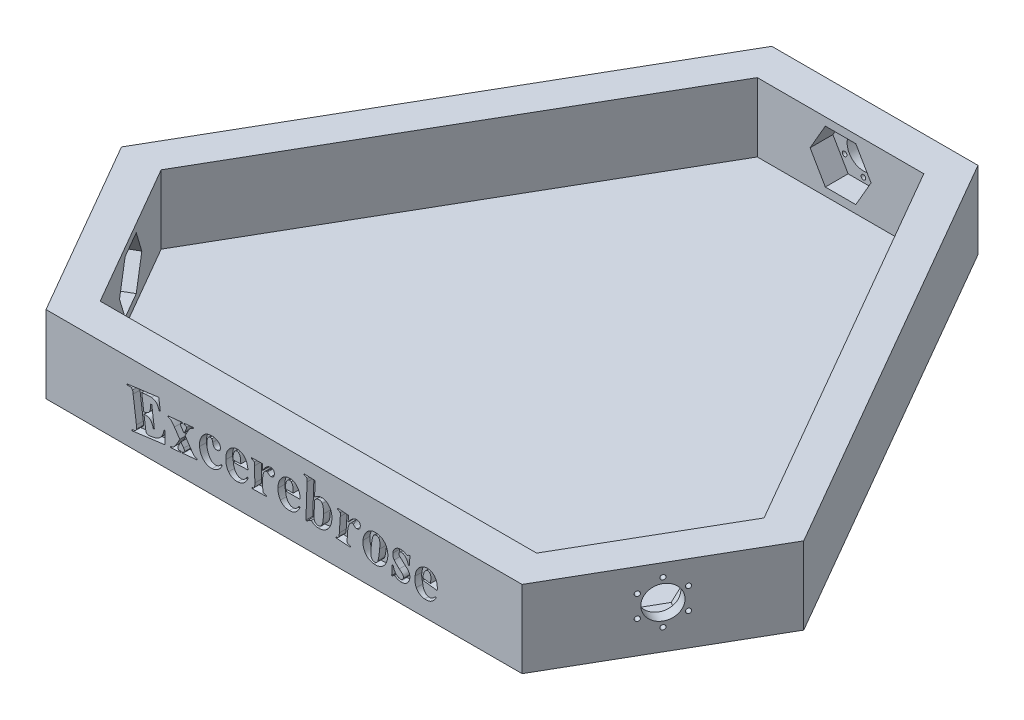
from build123d import *

# Parameters (mm, degrees)
BOSS_EXTRUDE1_DEPTH = 6.35
BOSS_EXTRUDE2_DEPTH = 50.8
BOSS_EXTRUDE3_DEPTH = 6.35
CUT_EXTRUDE1_REACH  = 510.334
SKETCH8_R           = 1.7
SKETCH8_R_2         = 12
CUT_EXTRUDE2_DEPTH  = 16.860000062
CIRPATTERN1_COUNT   = 3
SKETCH14_W          = 768.498396818
SKETCH14_H          = 578.969438033
CUT_EXTRUDE3_DEPTH  = 6.35
CUT_EXTRUDE4_DEPTH  = 5.08


with BuildPart() as part:
    # Sketch2 → Boss-Extrude1 (new body)
    with BuildSketch(Plane(origin=(0, 0, 0), x_dir=(1, 0, 0), z_dir=(0, 1, 0))):
        Polygon((76.2, 284.382271537), (-76.2, 284.382271537), (-252.176362049, -20.417728463), (-175.976362049, -152.4), (175.976362049, -152.4), (252.176362049, -20.417728463), align=None)
    extrude(amount=BOSS_EXTRUDE1_DEPTH)

    # Sketch3 → Boss-Extrude2 (add)
    with BuildSketch(Plane(origin=(0, 6.35, 0), x_dir=(1, 0, 0), z_dir=(0, 1, 0))):
        Polygon((76.2, 284.382271537), (-76.2, 284.382271537), (-252.176362049, -20.417728463), (-175.976362049, -152.4), (175.976362049, -152.4), (252.176362049, -20.417728463), align=None)
        Polygon((-161.311665212, -127), (161.311665212, -127), (222.846968374, -20.417728463), (61.535303163, 258.982271537), (-61.535303163, 258.982271537), (-222.846968374, -20.417728463), align=None, mode=Mode.SUBTRACT)
    extrude(amount=BOSS_EXTRUDE2_DEPTH)

    # Sketch4 → Boss-Extrude3 (add)
    with BuildSketch(Plane(origin=(0, 57.15, 0), x_dir=(1, 0, 0), z_dir=(0, 1, 0))):
        Polygon((-61.535303163, 258.982271537), (-61.535303163, 182.782271537), (-156.855832606, 17.682271537), (-222.846968374, -20.417728463), (-244.84401363, -33.117728463), (-183.308710468, -139.7), (-161.311665212, -127), (-95.320529443, -88.9), (95.320529443, -88.9), (161.311665212, -127), (183.308710468, -139.7), (244.84401363, -33.117728463), (222.846968374, -20.417728463), (156.855832606, 17.682271537), (61.535303163, 182.782271537), (61.535303163, 258.982271537), (61.535303163, 284.382271537), (-61.535303163, 284.382271537), align=None)
    extrude(amount=BOSS_EXTRUDE3_DEPTH)

    # Sketch8 → Cut-Extrude1 (cut, up to next)
    with BuildSketch(Plane(origin=(0, 0, -284.382271537), x_dir=(-1, 0, 0), z_dir=(0, 0, -1)), mode=Mode.PRIVATE) as cut_extrude1_sk1:
        with Locations((-13.856406461, 39.75)):
            Circle(SKETCH8_R)
    cut_extrude1_tool1 = extrude(cut_extrude1_sk1.sketch, amount=-CUT_EXTRUDE1_REACH, mode=Mode.PRIVATE) & part.part
    # Sketch8 → Cut-Extrude1 (cut, up to next)
    with BuildSketch(Plane(origin=(0, 0, -284.382271537), x_dir=(-1, 0, 0), z_dir=(0, 0, -1)), mode=Mode.PRIVATE) as cut_extrude1_sk2:
        with Locations((0, 47.75)):
            Circle(SKETCH8_R)
    cut_extrude1_tool2 = extrude(cut_extrude1_sk2.sketch, amount=-CUT_EXTRUDE1_REACH, mode=Mode.PRIVATE) & part.part
    # Sketch8 → Cut-Extrude1 (cut, up to next)
    with BuildSketch(Plane(origin=(0, 0, -284.382271537), x_dir=(-1, 0, 0), z_dir=(0, 0, -1)), mode=Mode.PRIVATE) as cut_extrude1_sk3:
        with Locations((13.856406461, 39.75)):
            Circle(SKETCH8_R)
    cut_extrude1_tool3 = extrude(cut_extrude1_sk3.sketch, amount=-CUT_EXTRUDE1_REACH, mode=Mode.PRIVATE) & part.part
    # Sketch8 → Cut-Extrude1 (cut, up to next)
    with BuildSketch(Plane(origin=(0, 0, -284.382271537), x_dir=(-1, 0, 0), z_dir=(0, 0, -1)), mode=Mode.PRIVATE) as cut_extrude1_sk4:
        with Locations((13.856406461, 23.75)):
            Circle(SKETCH8_R)
    cut_extrude1_tool4 = extrude(cut_extrude1_sk4.sketch, amount=-CUT_EXTRUDE1_REACH, mode=Mode.PRIVATE) & part.part
    # Sketch8 → Cut-Extrude1 (cut, up to next)
    with BuildSketch(Plane(origin=(0, 0, -284.382271537), x_dir=(-1, 0, 0), z_dir=(0, 0, -1)), mode=Mode.PRIVATE) as cut_extrude1_sk5:
        with Locations((-13.856406461, 23.75)):
            Circle(SKETCH8_R)
    cut_extrude1_tool5 = extrude(cut_extrude1_sk5.sketch, amount=-CUT_EXTRUDE1_REACH, mode=Mode.PRIVATE) & part.part
    # Sketch8 → Cut-Extrude1 (cut, up to next)
    with BuildSketch(Plane(origin=(0, 0, -284.382271537), x_dir=(-1, 0, 0), z_dir=(0, 0, -1)), mode=Mode.PRIVATE) as cut_extrude1_sk6:
        with Locations((0, 31.75)):
            Circle(SKETCH8_R_2)
    cut_extrude1_tool6 = extrude(cut_extrude1_sk6.sketch, amount=-CUT_EXTRUDE1_REACH, mode=Mode.PRIVATE) & part.part
    # Sketch8 → Cut-Extrude1 (cut, up to next)
    with BuildSketch(Plane(origin=(0, 0, -284.382271537), x_dir=(-1, 0, 0), z_dir=(0, 0, -1)), mode=Mode.PRIVATE) as cut_extrude1_sk7:
        with Locations((0, 15.75)):
            Circle(SKETCH8_R)
    cut_extrude1_tool7 = extrude(cut_extrude1_sk7.sketch, amount=-CUT_EXTRUDE1_REACH, mode=Mode.PRIVATE) & part.part
    cut_extrude1_1 = cut_extrude1_tool1.solids().sort_by_distance((13.856406, 39.75, -284.382272))[0]
    add(cut_extrude1_1, mode=Mode.SUBTRACT)
    cut_extrude1_2 = cut_extrude1_tool2.solids().sort_by_distance((0, 47.75, -284.382272))[0]
    add(cut_extrude1_2, mode=Mode.SUBTRACT)
    cut_extrude1_3 = cut_extrude1_tool3.solids().sort_by_distance((-13.856406, 39.75, -284.382272))[0]
    add(cut_extrude1_3, mode=Mode.SUBTRACT)
    cut_extrude1_4 = cut_extrude1_tool4.solids().sort_by_distance((-13.856406, 23.75, -284.382272))[0]
    add(cut_extrude1_4, mode=Mode.SUBTRACT)
    cut_extrude1_5 = cut_extrude1_tool5.solids().sort_by_distance((13.856406, 23.75, -284.382272))[0]
    add(cut_extrude1_5, mode=Mode.SUBTRACT)
    cut_extrude1_6 = cut_extrude1_tool6.solids().sort_by_distance((0, 31.75, -284.382272))[0]
    add(cut_extrude1_6, mode=Mode.SUBTRACT)
    cut_extrude1_7 = cut_extrude1_tool7.solids().sort_by_distance((0, 15.75, -284.382272))[0]
    add(cut_extrude1_7, mode=Mode.SUBTRACT)
    cut_extrude1 = cut_extrude1_1 + cut_extrude1_2 + cut_extrude1_3 + cut_extrude1_4 + cut_extrude1_5 + cut_extrude1_6 + cut_extrude1_7  # Cut-Extrude1 as one shape, for the pattern or mirror that repeats it

    # Sketch9 → Cut-Extrude2 (cut)
    with BuildSketch(Plane.XY.offset(-258.982271537)):
        Polygon((11.258922037, 51.251025006), (-11.258922037, 51.251025006), (-22.517844073, 31.75), (-11.258922037, 12.248974994), (11.258922037, 12.248974994), (22.517844073, 31.75), align=None)
    cut_extrude2 = extrude(amount=-CUT_EXTRUDE2_DEPTH, mode=Mode.SUBTRACT)

    # CirPattern1: Cut-Extrude1, Cut-Extrude2 ×3 about axis
    cirpattern1_axis = Axis((0, 63.5, -37.188181024), (0, -1, 0))
    add([cut_extrude1.rotate(cirpattern1_axis, i * 360 / CIRPATTERN1_COUNT) for i in range(1, CIRPATTERN1_COUNT)], mode=Mode.SUBTRACT)
    add([cut_extrude2.rotate(cirpattern1_axis, i * 360 / CIRPATTERN1_COUNT) for i in range(1, CIRPATTERN1_COUNT)], mode=Mode.SUBTRACT)

    # Sketch14 → Cut-Extrude3 (cut)
    with BuildSketch(Plane(origin=(0, 63.5, 0), x_dir=(1, 0, 0), z_dir=(0, 1, 0))):
        with Locations((0, 37.188181025)):
            Rectangle(SKETCH14_W, SKETCH14_H)
    extrude(amount=-CUT_EXTRUDE3_DEPTH, mode=Mode.SUBTRACT)

    # Sketch15 → Cut-Extrude4 (cut)
    # profile 1 of 11: a face of its own
    with BuildSketch(Plane.XY.offset(152.4)):
        with BuildLine():
            Line((-105.209606785, 39.32052651), (-103.703929597, 27.841293404))
            Line((-103.703929597, 27.841293404), (-103.143967006, 27.909733276))
            add(Edge.make_bspline(
                [(-103.143967006, 27.909733276), (-102.929637614, 27.943387164), (-102.513947056, 28.008658675), (-101.919280653, 28.16441138), (-101.375346888, 28.367607249), (-100.886775293, 28.623749086), (-100.453074574, 28.925788548), (-100.067340333, 29.268369294), (-99.743422268, 29.6661932), (-99.465595879, 30.107296411), (-99.239839276, 30.597608099), (-99.036975142, 31.128453458), (-98.88016891, 31.708904151), (-98.746573598, 32.333505004), (-98.657944589, 33.005655189), (-98.593740703, 33.723781107), (-98.571158736, 34.488162221), (-98.579234303, 35.012973557), (-98.583382797, 35.282574051)],
                knots=[0, 0, 0, 0, 1.066975601, 2.069392711, 3.018889728, 3.918088167, 4.775799004, 5.613922436, 6.447498771, 7.291194482, 8.172142687, 9.098941493, 10.084333953, 11.127025522, 12.239672718, 13.417599844, 14.673396878, 16, 16, 16, 16], degree=3))
            Line((-98.583382797, 35.282574051), (-97.793213364, 35.388344763))
            Line((-97.793213364, 35.388344763), (-95.852009716, 20.617775986))
            Line((-95.852009716, 20.617775986), (-96.64217915, 20.512005274))
            add(Edge.make_bspline(
                [(-96.64217915, 20.512005274), (-96.739101288, 20.891534491), (-96.924557934, 21.617748511), (-97.298709597, 22.630546594), (-97.705201607, 23.535016394), (-98.189770496, 24.306223458), (-98.694906248, 24.960541612), (-99.218795911, 25.494182871), (-99.764933964, 25.897101622), (-100.350730109, 26.172444357), (-101.000165576, 26.324604738), (-101.738085556, 26.396518818), (-102.584249788, 26.376771275), (-103.181705514, 26.313291246), (-103.49860998, 26.279619957)],
                knots=[0, 0, 0, 0, 1.385240686, 2.650602806, 3.816256342, 4.887515794, 5.865295102, 6.73715797, 7.525508139, 8.254429084, 9.010945518, 9.874146819, 10.872397837, 12, 12, 12, 12], degree=3))
            Line((-103.49860998, 26.279619957), (-102.447124672, 18.328151171))
            add(Edge.make_bspline(
                [(-102.447124672, 18.328151171), (-102.422692787, 18.143512904), (-102.376253112, 17.792555902), (-102.303503056, 17.296470972), (-102.225570067, 16.859763425), (-102.161571184, 16.476413149), (-102.085939313, 16.15162436), (-102.017837245, 15.883981253), (-101.958553353, 15.671627492), (-101.870513409, 15.46817324), (-101.729259702, 15.268221022), (-101.536634842, 15.0600723), (-101.300908078, 14.883084322), (-101.020697049, 14.737502683), (-100.679565193, 14.626530663), (-100.264297773, 14.586565129), (-99.774699085, 14.587286821), (-99.425199092, 14.624674239), (-99.236672486, 14.644841687)],
                knots=[0, 0, 0, 0, 1.525841325, 2.900290967, 4.106978222, 5.160117638, 6.083409294, 6.837529018, 7.423394774, 7.887457408, 8.646156849, 9.415436275, 10.203804664, 11.047364024, 11.993052058, 13.122635511, 14.447897646, 16, 16, 16, 16], degree=3))
            Line((-99.236672486, 14.644841687), (-97.550562908, 14.868826723))
            add(Edge.make_bspline(
                [(-97.550562908, 14.868826723), (-97.230488594, 14.916668915), (-96.605333205, 15.010112228), (-95.699721151, 15.214468173), (-94.853661247, 15.478947443), (-94.05704529, 15.779040951), (-93.323917401, 16.144402135), (-92.638715346, 16.544423069), (-92.020565021, 17.012016325), (-91.451639955, 17.521558556), (-90.935004084, 18.087269281), (-90.478751906, 18.710524013), (-90.063146735, 19.383729146), (-89.695418461, 20.10799492), (-89.392344003, 20.896272244), (-89.133343036, 21.731930372), (-88.917420402, 22.623028236), (-88.821079182, 23.238390167), (-88.771593849, 23.554468683)],
                knots=[0, 0, 0, 0, 1.152234553, 2.250494989, 3.301709645, 4.307041389, 5.278096913, 6.215368677, 7.128200403, 8.032869356, 8.932065404, 9.85082322, 10.779295488, 11.747031347, 12.73859676, 13.782757165, 14.86112093, 16, 16, 16, 16], degree=3))
            Line((-88.771593849, 23.554468683), (-88.000089836, 23.660239394))
            Line((-88.000089836, 23.660239394), (-88.087195128, 14.526627362))
            Line((-88.087195128, 14.526627362), (-112.470455042, 11.316175176))
            Line((-112.470455042, 11.316175176), (-112.570003947, 12.08767919))
            Line((-112.570003947, 12.08767919), (-111.630511156, 12.212115321))
            add(Edge.make_bspline(
                [(-111.630511156, 12.212115321), (-111.436714686, 12.243159377), (-111.067777501, 12.302259042), (-110.551718602, 12.453087744), (-110.098656721, 12.644874789), (-109.842389045, 12.823797882), (-109.720416542, 12.908957656)],
                knots=[0, 0, 0, 0, 1.144796064, 2.179388699, 3.133466534, 4, 4, 4, 4], degree=3))
            add(Edge.make_bspline(
                [(-109.720416542, 12.908957656), (-109.641295109, 12.974920826), (-109.480424174, 13.109038175), (-109.278657784, 13.362368606), (-109.12178452, 13.667746051), (-109.05317582, 13.892739237), (-109.0173524, 14.010217417)],
                knots=[0, 0, 0, 0, 0.926440779, 1.883653892, 2.894968801, 4, 4, 4, 4], degree=3))
            add(Edge.make_bspline(
                [(-109.0173524, 14.010217417), (-109.003280486, 14.061784116), (-108.970526913, 14.181809975), (-108.959928027, 14.391810448), (-108.952467255, 14.650951228), (-108.960715163, 14.958225589), (-108.977950529, 15.315318813), (-109.018991368, 15.721493942), (-109.067110954, 16.177955629), (-109.107973216, 16.49901103), (-109.129344919, 16.666928819)],
                knots=[0, 0, 0, 0, 0.47914247, 1.115244673, 1.879567681, 2.811578134, 3.875327899, 5.091849163, 6.47898445, 8, 8, 8, 8], degree=3))
            Line((-109.129344919, 16.666928819), (-111.574514897, 35.220355986))
            add(Edge.make_bspline(
                [(-111.574514897, 35.220355986), (-111.612856584, 35.508810598), (-111.681347894, 36.024088772), (-111.785318328, 36.702849561), (-111.875872354, 37.197106482), (-111.95464287, 37.458504417), (-111.98515413, 37.559755253)],
                knots=[0, 0, 0, 0, 1.468359222, 2.622989629, 3.466623747, 4, 4, 4, 4], degree=3))
            add(Edge.make_bspline(
                [(-111.98515413, 37.559755253), (-112.040121513, 37.671378408), (-112.146261292, 37.886918179), (-112.35431276, 38.177136428), (-112.613468468, 38.407808454), (-112.8086595, 38.526949674), (-112.905981501, 38.586353335)],
                knots=[0, 0, 0, 0, 1.061431564, 2.049581152, 3.027523628, 4, 4, 4, 4], degree=3))
            add(Edge.make_bspline(
                [(-112.905981501, 38.586353335), (-113.059533125, 38.656269823), (-113.377882001, 38.801223258), (-113.916470305, 38.914599835), (-114.514309734, 38.943759854), (-114.928320315, 38.901159487), (-115.145831864, 38.878778244)],
                knots=[0, 0, 0, 0, 0.880465389, 1.825413246, 2.857522602, 4, 4, 4, 4], degree=3))
            Line((-115.145831864, 38.878778244), (-116.085324654, 38.754342112))
            Line((-116.085324654, 38.754342112), (-116.184873559, 39.525846126))
            Line((-116.184873559, 39.525846126), (-92.573117658, 42.636749407))
            Line((-92.573117658, 42.636749407), (-91.471857897, 34.293306808))
            Line((-91.471857897, 34.293306808), (-92.26202733, 34.187536096))
            add(Edge.make_bspline(
                [(-92.26202733, 34.187536096), (-92.344900028, 34.426844594), (-92.506047908, 34.892185506), (-92.774647755, 35.552272375), (-93.04003619, 36.161283508), (-93.319220703, 36.710638767), (-93.614066552, 37.202685301), (-93.907935036, 37.645044563), (-94.214634472, 38.027593567), (-94.631837311, 38.463738039), (-95.219240268, 38.921072815), (-96.012833206, 39.367581731), (-96.911299708, 39.706530898), (-97.554412627, 39.837657559), (-97.886540462, 39.905376326)],
                knots=[0, 0, 0, 0, 1.068361054, 2.077452799, 3.005923303, 3.870816625, 4.675205108, 5.425156973, 6.10983147, 6.741088363, 7.968325897, 9.233898858, 10.571480754, 12, 12, 12, 12], degree=3))
            add(Edge.make_bspline(
                [(-97.886540462, 39.905376326), (-97.998370976, 39.921456874), (-98.239848389, 39.956179858), (-98.637009762, 39.977133995), (-99.093740195, 39.98509339), (-99.614297462, 39.96011374), (-100.197647867, 39.933249349), (-100.842936238, 39.87572265), (-101.549285394, 39.790697018), (-102.040637877, 39.731197495), (-102.297801314, 39.70005671)],
                knots=[0, 0, 0, 0, 0.61198101, 1.321460361, 2.153218324, 3.086660011, 4.14461445, 5.317833409, 6.596211063, 8, 8, 8, 8], degree=3))
            Line((-102.297801314, 39.70005671), (-105.209606785, 39.32052651))
        make_face()
    # profile 2 of 11: a face of its own
    with BuildSketch(Plane.XY.offset(152.4)):
        with BuildLine():
            Line((-73.110656522, 27.868224408), (-69.097591289, 21.795741204))
            add(Edge.make_bspline(
                [(-69.097591289, 21.795741204), (-68.931057887, 21.541726277), (-68.613413237, 21.057219981), (-68.13538147, 20.378361629), (-67.700640244, 19.765643666), (-67.278370394, 19.239699531), (-66.902889286, 18.774072289), (-66.550420559, 18.38897515), (-66.226089493, 18.078657002), (-66.010721565, 17.909821536), (-65.91202633, 17.832450424)],
                knots=[0, 0, 0, 0, 1.427686067, 2.723158435, 3.902974713, 4.958144399, 5.893103878, 6.714182369, 7.410756864, 8, 8, 8, 8], degree=3))
            add(Edge.make_bspline(
                [(-65.91202633, 17.832450424), (-65.804127517, 17.768080376), (-65.583275064, 17.636324683), (-65.200175896, 17.513974329), (-64.773439393, 17.451451407), (-64.474981306, 17.460593455), (-64.31924385, 17.465363837)],
                knots=[0, 0, 0, 0, 0.903769706, 1.849879075, 2.878052304, 4, 4, 4, 4], degree=3))
            Line((-64.31924385, 17.465363837), (-64.244582171, 16.718747049))
            Line((-64.244582171, 16.718747049), (-75.082969202, 15.636152708))
            Line((-75.082969202, 15.636152708), (-75.15763088, 16.382769495))
            add(Edge.make_bspline(
                [(-75.15763088, 16.382769495), (-74.968467916, 16.420330823), (-74.627781536, 16.487979546), (-74.17936672, 16.602047201), (-73.847933292, 16.718078784), (-73.580001488, 16.883848195), (-73.385385117, 17.160948977), (-73.380612721, 17.404272366), (-73.378194204, 17.527581902)],
                knots=[0, 0, 0, 0, 1.480699639, 2.666770441, 3.554173039, 4.163820335, 5.069475133, 6, 6, 6, 6], degree=3))
            add(Edge.make_bspline(
                [(-73.378194204, 17.527581902), (-73.399355855, 17.638602247), (-73.447926672, 17.893419269), (-73.630183385, 18.296102579), (-73.896442784, 18.770192798), (-74.1123353, 19.10498452), (-74.230581703, 19.288353159)],
                knots=[0, 0, 0, 0, 0.686321692, 1.575264873, 2.671949295, 4, 4, 4, 4], degree=3))
            Line((-74.230581703, 19.288353159), (-76.227781609, 22.287263922))
            Line((-76.227781609, 22.287263922), (-77.459699308, 20.041191753))
            add(Edge.make_bspline(
                [(-77.459699308, 20.041191753), (-77.526052541, 19.918823967), (-77.650790995, 19.688782899), (-77.827011826, 19.364232869), (-77.974745206, 19.07925625), (-78.101899792, 18.832763206), (-78.205056387, 18.625122028), (-78.289101301, 18.456435477), (-78.342990793, 18.325954321), (-78.374246288, 18.253432833), (-78.386748486, 18.224424237)],
                knots=[0, 0, 0, 0, 1.637300819, 3.077986764, 4.343651293, 5.412816368, 6.340105148, 7.0711083, 7.62844332, 8, 8, 8, 8], degree=3))
            add(Edge.make_bspline(
                [(-78.386748486, 18.224424237), (-78.422311712, 18.096690724), (-78.488109376, 17.860363269), (-78.48686787, 17.615301904), (-78.486297391, 17.502694676)],
                knots=[0, 0, 0, 0, 1.080987504, 2, 2, 2, 2], degree=3))
            add(Edge.make_bspline(
                [(-78.486297391, 17.502694676), (-78.463858388, 17.355060965), (-78.421506591, 17.076414318), (-78.227851323, 16.714409561), (-77.955718029, 16.449886299), (-77.670070118, 16.298358298), (-77.385580352, 16.236160777), (-77.098930491, 16.223505759), (-76.745715906, 16.230344911), (-76.486935594, 16.25249277), (-76.345995933, 16.264555171)],
                knots=[0, 0, 0, 0, 1.248830229, 2.357065701, 3.380950466, 4.403050423, 5.029351165, 5.816092453, 6.81057725, 8, 8, 8, 8], degree=3))
            Line((-76.345995933, 16.264555171), (-76.271334255, 15.517938383))
            Line((-76.271334255, 15.517938383), (-83.886825486, 14.758877983))
            Line((-83.886825486, 14.758877983), (-83.961487165, 15.50549477))
            add(Edge.make_bspline(
                [(-83.961487165, 15.50549477), (-83.729763935, 15.537767103), (-83.272897393, 15.601395377), (-82.61698752, 15.820644566), (-82.003114984, 16.127821453), (-81.516379922, 16.46416603), (-81.139024339, 16.819012027), (-80.830588073, 17.17316914), (-80.485684141, 17.600357316), (-80.132357096, 18.12171521), (-79.735231938, 18.712357452), (-79.320727144, 19.392582424), (-78.881893295, 20.155593741), (-78.584976072, 20.693991721), (-78.430301132, 20.974462738)],
                knots=[0, 0, 0, 0, 1.032544259, 2.035768821, 3.04037509, 4.060427527, 4.637773841, 5.326109541, 6.135153281, 7.063564288, 8.108732598, 9.281843692, 10.584013888, 12, 12, 12, 12], degree=3))
            Line((-78.430301132, 20.974462738), (-77.067725495, 23.506738008))
            Line((-77.067725495, 23.506738008), (-81.031016274, 29.367679789))
            add(Edge.make_bspline(
                [(-81.031016274, 29.367679789), (-81.188309243, 29.596033529), (-81.488244264, 30.031471197), (-81.921015089, 30.648956584), (-82.326898513, 31.191553395), (-82.697735022, 31.662937598), (-83.034527191, 32.064790399), (-83.336667667, 32.393850968), (-83.604663297, 32.654306099), (-83.915406873, 32.901827772), (-84.29887973, 33.119890347), (-84.764533364, 33.310961074), (-85.249671223, 33.429726914), (-85.580572592, 33.438531121), (-85.747145648, 33.442963087)],
                knots=[0, 0, 0, 0, 1.533032841, 2.923272663, 4.168494841, 5.278755841, 6.238901758, 7.066529704, 7.747775191, 8.302905691, 9.258659837, 10.174227487, 11.080920982, 12, 12, 12, 12], degree=3))
            Line((-85.747145648, 33.442963087), (-85.828029133, 34.208245294))
            Line((-85.828029133, 34.208245294), (-75.051860169, 35.278396022))
            Line((-75.051860169, 35.278396022), (-74.970976683, 34.513113815))
            Line((-74.970976683, 34.513113815), (-75.530939274, 34.43223033))
            Line((-75.530939274, 34.43223033), (-76.576202776, 33.953151225))
            add(Edge.make_bspline(
                [(-76.576202776, 33.953151225), (-76.618513081, 33.886581), (-76.71444159, 33.735648919), (-76.701596644, 33.55588423), (-76.694417101, 33.4554067)],
                knots=[0, 0, 0, 0, 0.882121611, 2, 2, 2, 2], degree=3))
            add(Edge.make_bspline(
                [(-76.694417101, 33.4554067), (-76.679723864, 33.350658796), (-76.649388839, 33.134400773), (-76.568260765, 32.931583724), (-76.526428324, 32.827004237)],
                knots=[0, 0, 0, 0, 0.968730807, 2, 2, 2, 2], degree=3))
            add(Edge.make_bspline(
                [(-76.526428324, 32.827004237), (-76.50147986, 32.787638865), (-76.430635997, 32.675856631), (-76.294647843, 32.454834122), (-76.080031844, 32.142219771), (-75.920173388, 31.896242229), (-75.829585989, 31.756853509)],
                knots=[0, 0, 0, 0, 0.437920811, 1.243523537, 2.437980463, 4, 4, 4, 4], degree=3))
            Line((-75.829585989, 31.756853509), (-74.031483893, 29.081476687))
            Line((-74.031483893, 29.081476687), (-73.353306977, 30.282285354))
            add(Edge.make_bspline(
                [(-73.353306977, 30.282285354), (-73.239867152, 30.478513487), (-73.024264003, 30.851463667), (-72.739538149, 31.394902917), (-72.492259132, 31.885725378), (-72.299933733, 32.332568759), (-72.152677412, 32.730736158), (-72.06037977, 33.080781707), (-71.999746401, 33.382866704), (-72.006368608, 33.56926824), (-72.00939676, 33.65450451)],
                knots=[0, 0, 0, 0, 1.482137643, 2.816943183, 4.011907694, 5.07514237, 5.997552485, 6.783878138, 7.443901089, 8, 8, 8, 8], degree=3))
            add(Edge.make_bspline(
                [(-72.00939676, 33.65450451), (-72.020826361, 33.723714063), (-72.043472666, 33.860844009), (-72.132558578, 34.054165275), (-72.27668312, 34.215138728), (-72.454911732, 34.365561155), (-72.694661831, 34.484291632), (-72.997783822, 34.569280248), (-73.368724756, 34.613244586), (-73.637346612, 34.624981218), (-73.78261163, 34.63132814)],
                knots=[0, 0, 0, 0, 0.753035385, 1.492044049, 2.252323491, 3.061189557, 3.989658336, 5.105786989, 6.434870814, 8, 8, 8, 8], degree=3))
            Line((-73.78261163, 34.63132814), (-73.863495115, 35.396610347))
            Line((-73.863495115, 35.396610347), (-66.975955252, 36.087230875))
            Line((-66.975955252, 36.087230875), (-66.895071767, 35.321948668))
            add(Edge.make_bspline(
                [(-66.895071767, 35.321948668), (-67.104025682, 35.284567088), (-67.517391264, 35.210616531), (-68.113503146, 34.989700075), (-68.678886644, 34.691689039), (-69.229179936, 34.29861897), (-69.766459095, 33.768323803), (-70.294051217, 33.065477832), (-70.847979674, 32.197334245), (-71.194993908, 31.546004883), (-71.380994297, 31.196890918)],
                knots=[0, 0, 0, 0, 0.798938776, 1.580510187, 2.384939492, 3.202971268, 4.120811438, 5.218711654, 6.509223355, 8, 8, 8, 8], degree=3))
            Line((-71.380994297, 31.196890918), (-73.110656522, 27.868224408))
        make_face()
    # profile 3 of 11: a face of its own
    with BuildSketch(Plane.XY.offset(152.4)):
        with BuildLine():
            Line((-46.333093799, 22.876326011), (-45.64247327, 22.422134132))
            add(Edge.make_bspline(
                [(-45.64247327, 22.422134132), (-45.743174958, 22.202865368), (-45.941941578, 21.770069135), (-46.286472119, 21.158154397), (-46.64729424, 20.581081587), (-47.034183092, 20.045163915), (-47.443101869, 19.54598288), (-47.879747905, 19.092559023), (-48.337078897, 18.676038901), (-48.978116713, 18.186514998), (-49.818326043, 17.664545562), (-50.881880034, 17.18453947), (-51.992233391, 16.856986499), (-52.756125052, 16.771907607), (-53.139750177, 16.729181129)],
                knots=[0, 0, 0, 0, 0.876016428, 1.729095389, 2.548312984, 3.346908319, 4.128120507, 4.889954247, 5.631253267, 6.372514016, 7.816923823, 9.212728945, 10.600237097, 12, 12, 12, 12], degree=3))
            add(Edge.make_bspline(
                [(-53.139750177, 16.729181129), (-53.459182965, 16.716218992), (-54.08655212, 16.690761227), (-55.008814322, 16.768066126), (-55.890318836, 16.934753954), (-56.729167986, 17.202596669), (-57.521816526, 17.574601544), (-58.277176927, 18.032525676), (-58.989357327, 18.587836735), (-59.642440445, 19.242762734), (-60.239244616, 19.960396702), (-60.782035359, 20.721457106), (-61.239180233, 21.533773525), (-61.634124464, 22.383985063), (-61.959866246, 23.276238425), (-62.205348243, 24.214188622), (-62.391380852, 25.193153135), (-62.449270952, 25.864113384), (-62.478681826, 26.204992522)],
                knots=[0, 0, 0, 0, 1.030281809, 2.023483662, 2.977181788, 3.918508417, 4.855189433, 5.794708195, 6.76210048, 7.760088335, 8.771524607, 9.769938267, 10.770500596, 11.773050807, 12.790837005, 13.829229266, 14.897147099, 16, 16, 16, 16], degree=3))
            add(Edge.make_bspline(
                [(-62.478681826, 26.204992522), (-62.496778909, 26.53469206), (-62.532518458, 27.185808753), (-62.487415565, 28.152540712), (-62.394197216, 29.095638265), (-62.216447259, 30.012415875), (-61.975855089, 30.903648176), (-61.659900398, 31.767558056), (-61.284093935, 32.610593584), (-60.977612336, 33.146770362), (-60.823681281, 33.416066327)],
                knots=[0, 0, 0, 0, 1.053430219, 2.080397218, 3.085709646, 4.076440735, 5.057769841, 6.029538351, 7.010331309, 8, 8, 8, 8], degree=3))
            add(Edge.make_bspline(
                [(-60.823681281, 33.416066327), (-60.625497631, 33.724014824), (-60.237700396, 34.326595188), (-59.545380927, 35.127402225), (-58.786185428, 35.820496546), (-57.957034888, 36.401939997), (-57.053926231, 36.867816788), (-56.085140387, 37.21860594), (-55.049299747, 37.478196393), (-54.329618705, 37.544498033), (-53.961028643, 37.578454916)],
                knots=[0, 0, 0, 0, 1.049087183, 2.052808643, 3.025335365, 3.990506039, 4.948079506, 5.930250579, 6.939962257, 8, 8, 8, 8], degree=3))
            add(Edge.make_bspline(
                [(-53.961028643, 37.578454916), (-53.714323987, 37.59288156), (-53.231343446, 37.621125001), (-52.521704664, 37.594144435), (-51.848764617, 37.517847387), (-51.208448545, 37.407166878), (-50.609851445, 37.219409224), (-50.041247805, 36.998820597), (-49.507129912, 36.724771698), (-49.020686214, 36.3933209), (-48.576654232, 36.036082402), (-48.181584518, 35.662782342), (-47.842617529, 35.272910119), (-47.551092107, 34.870717374), (-47.331673273, 34.443573921), (-47.149039176, 34.011713595), (-47.038159079, 33.557639882), (-47.003752806, 33.248563438), (-46.986383488, 33.092532385)],
                knots=[0, 0, 0, 0, 1.290082698, 2.525630636, 3.702628691, 4.826443084, 5.912673096, 6.972664435, 8.009378557, 9.039792823, 10.041221052, 10.983559315, 11.874114673, 12.736629262, 13.570019533, 14.376582631, 15.180450257, 16, 16, 16, 16], degree=3))
            add(Edge.make_bspline(
                [(-46.986383488, 33.092532385), (-46.981129585, 32.901294688), (-46.971048768, 32.534361288), (-47.074472098, 32.005768209), (-47.266897012, 31.527554015), (-47.563304028, 31.116459359), (-47.934794894, 30.776425537), (-48.373923577, 30.515204613), (-48.879168048, 30.345632745), (-49.239481353, 30.306620314), (-49.42533166, 30.286497626)],
                knots=[0, 0, 0, 0, 1.093133525, 2.097427481, 3.061635182, 4.024304428, 4.974576374, 5.928184829, 6.931353683, 8, 8, 8, 8], degree=3))
            add(Edge.make_bspline(
                [(-49.42533166, 30.286497626), (-49.624825344, 30.283278166), (-50.010934064, 30.277047085), (-50.574630767, 30.390125658), (-51.084191545, 30.621074692), (-51.557588158, 30.950982117), (-51.969381864, 31.435016472), (-52.294689771, 32.082473006), (-52.564106879, 32.887030783), (-52.671157429, 33.484558841), (-52.729110944, 33.80804014)],
                knots=[0, 0, 0, 0, 0.883245268, 1.709471165, 2.524821465, 3.349253278, 4.249200838, 5.310818099, 6.544168691, 8, 8, 8, 8], degree=3))
            add(Edge.make_bspline(
                [(-52.729110944, 33.80804014), (-52.76890222, 34.010142399), (-52.842800929, 34.385478342), (-52.999693299, 34.894056308), (-53.199487835, 35.307261523), (-53.384172828, 35.515943308), (-53.469505925, 35.612364043)],
                knots=[0, 0, 0, 0, 1.247720089, 2.317214054, 3.222474266, 4, 4, 4, 4], degree=3))
            add(Edge.make_bspline(
                [(-53.469505925, 35.612364043), (-53.5561405, 35.68636128), (-53.724773695, 35.830396044), (-54.01393652, 35.983265037), (-54.323953012, 36.061323532), (-54.533038379, 36.06066732), (-54.639205558, 36.060334115)],
                knots=[0, 0, 0, 0, 1.058164045, 2.059704025, 3.014776808, 4, 4, 4, 4], degree=3))
            add(Edge.make_bspline(
                [(-54.639205558, 36.060334115), (-54.802089836, 36.037160929), (-55.129938768, 35.990518585), (-55.575377877, 35.731174548), (-55.981758299, 35.362136859), (-56.181731978, 35.037981314), (-56.287984297, 34.865747255)],
                knots=[0, 0, 0, 0, 0.922493936, 1.856770069, 2.86123438, 4, 4, 4, 4], degree=3))
            add(Edge.make_bspline(
                [(-56.287984297, 34.865747255), (-56.366202873, 34.718037136), (-56.528352163, 34.411829936), (-56.708210188, 33.906083324), (-56.859850058, 33.353243037), (-56.969724504, 32.747295682), (-57.041951522, 32.090399666), (-57.080641333, 31.382019712), (-57.07027324, 30.624031596), (-57.042641076, 30.101829892), (-57.028379278, 29.832305747)],
                knots=[0, 0, 0, 0, 0.777083035, 1.610914818, 2.491439609, 3.443804302, 4.473599959, 5.565969838, 6.743723178, 8, 8, 8, 8], degree=3))
            add(Edge.make_bspline(
                [(-57.028379278, 29.832305747), (-56.986732784, 29.37702606), (-56.903861077, 28.471072137), (-56.636344254, 27.139576294), (-56.267500112, 25.843655345), (-55.876799645, 24.799926274), (-55.514881407, 24.002303569), (-55.218461703, 23.448928927), (-54.920499868, 22.928462463), (-54.584559231, 22.463021324), (-54.243535028, 22.029875716), (-53.885114226, 21.639586266), (-53.507862353, 21.289629577), (-53.237126846, 21.0902982), (-53.102419338, 20.991118623)],
                knots=[0, 0, 0, 0, 1.65253657, 3.288356659, 4.90288534, 6.521764216, 7.313884245, 8.06883624, 8.791809893, 9.4806706, 10.142539254, 10.784865188, 11.395395956, 12, 12, 12, 12], degree=3))
            add(Edge.make_bspline(
                [(-53.102419338, 20.991118623), (-52.895050092, 20.864112215), (-52.485074754, 20.613016664), (-51.792342624, 20.38960241), (-51.064950447, 20.253114386), (-50.564533701, 20.272120721), (-50.308828192, 20.281832675)],
                knots=[0, 0, 0, 0, 0.99080912, 1.958859919, 2.957007797, 4, 4, 4, 4], degree=3))
            add(Edge.make_bspline(
                [(-50.308828192, 20.281832675), (-50.13801624, 20.297865134), (-49.800701984, 20.329525546), (-49.307594007, 20.459691338), (-48.834774855, 20.64771231), (-48.364764772, 20.895660539), (-47.89341612, 21.240374109), (-47.399225383, 21.685326271), (-46.868176187, 22.237392605), (-46.519159605, 22.654147779), (-46.333093799, 22.876326011)],
                knots=[0, 0, 0, 0, 0.839040305, 1.656911321, 2.486803131, 3.327440322, 4.251945975, 5.33835986, 6.581041004, 8, 8, 8, 8], degree=3))
        make_face()
    # profile 4 of 11: a face of its own
    with BuildSketch(Plane.XY.offset(152.4)):
        with BuildLine():
            Line((-26.71976559, 29.100730905), (-37.489712748, 28.665204446))
            add(Edge.make_bspline(
                [(-37.489712748, 28.665204446), (-37.456431489, 28.349413647), (-37.391333119, 27.731724678), (-37.227870212, 26.836104217), (-37.020097439, 25.992170067), (-36.749779619, 25.204872289), (-36.433167689, 24.46747183), (-36.065717916, 23.782250731), (-35.651409883, 23.145394988), (-35.324794567, 22.767670786), (-35.162757094, 22.580277628)],
                knots=[0, 0, 0, 0, 1.14906223, 2.247573607, 3.292688491, 4.292156882, 5.257199906, 6.194273297, 7.104158997, 8, 8, 8, 8], degree=3))
            add(Edge.make_bspline(
                [(-35.162757094, 22.580277628), (-35.036455117, 22.447329886), (-34.788486859, 22.186314017), (-34.385216518, 21.841572992), (-33.957346983, 21.562445978), (-33.521773756, 21.328873202), (-33.067027486, 21.15076723), (-32.594252778, 21.034835179), (-32.105578407, 20.969114101), (-31.776209774, 20.973061047), (-31.610105547, 20.975051536)],
                knots=[0, 0, 0, 0, 1.090419448, 2.140816949, 3.14673556, 4.123486441, 5.076500009, 6.042912953, 7.013019459, 8, 8, 8, 8], degree=3))
            add(Edge.make_bspline(
                [(-31.610105547, 20.975051536), (-31.405911429, 20.99161153), (-31.000313842, 21.024505199), (-30.412152596, 21.183951414), (-29.856551185, 21.430122025), (-29.325637342, 21.771380223), (-28.803707546, 22.225610938), (-28.293135733, 22.8232363), (-27.753825405, 23.544496573), (-27.424001477, 24.092959133), (-27.248619147, 24.384601531)],
                knots=[0, 0, 0, 0, 0.845698209, 1.679838554, 2.505293393, 3.34981681, 4.279995898, 5.355385748, 6.593738759, 8, 8, 8, 8], degree=3))
            Line((-27.248619147, 24.384601531), (-26.514445973, 23.955296878))
            add(Edge.make_bspline(
                [(-26.514445973, 23.955296878), (-26.636392826, 23.686571845), (-26.873353802, 23.164398906), (-27.259747771, 22.42307715), (-27.659256273, 21.742525902), (-28.068502737, 21.116408886), (-28.497276902, 20.553233914), (-28.933910021, 20.04228086), (-29.386825851, 19.596355655), (-29.851979176, 19.203704619), (-30.336397351, 18.868084132), (-30.834466542, 18.565155712), (-31.358143478, 18.311541308), (-31.900907796, 18.098512802), (-32.465591736, 17.931240733), (-33.049292055, 17.799660319), (-33.654925622, 17.712832395), (-34.065404324, 17.685232991), (-34.273038755, 17.671272251)],
                knots=[0, 0, 0, 0, 1.334444971, 2.593026199, 3.778610131, 4.902442177, 5.973608191, 6.977752065, 7.939470673, 8.844979406, 9.727111465, 10.60218415, 11.478914125, 12.355041812, 13.236375651, 14.139793081, 15.059042516, 16, 16, 16, 16], degree=3))
            add(Edge.make_bspline(
                [(-34.273038755, 17.671272251), (-34.628007234, 17.667379136), (-35.317420695, 17.659817996), (-36.323643894, 17.782244625), (-37.266822398, 18.002710041), (-38.150570658, 18.335693719), (-38.970096725, 18.780900176), (-39.727780937, 19.332287423), (-40.423283477, 19.993302877), (-40.820545868, 20.502907342), (-41.023698875, 20.763510112)],
                knots=[0, 0, 0, 0, 1.097189805, 2.130942511, 3.126892291, 4.087325546, 5.043312575, 6.003231382, 6.97888761, 8, 8, 8, 8], degree=3))
            add(Edge.make_bspline(
                [(-41.023698875, 20.763510112), (-41.177071938, 20.987039522), (-41.487020169, 21.438765159), (-41.880220001, 22.167851517), (-42.225514705, 22.936561375), (-42.511081155, 23.748510088), (-42.741804366, 24.6033356), (-42.912461379, 25.502259424), (-43.041186506, 26.442935685), (-43.077201516, 27.086539216), (-43.09556046, 27.414621327)],
                knots=[0, 0, 0, 0, 0.920003572, 1.859214857, 2.808119415, 3.779290965, 4.77870291, 5.811838923, 6.884567177, 8, 8, 8, 8], degree=3))
            add(Edge.make_bspline(
                [(-43.09556046, 27.414621327), (-43.104201696, 27.812935125), (-43.121099754, 28.591843317), (-43.035272437, 29.733735038), (-42.878597909, 30.818968905), (-42.629764843, 31.844382867), (-42.292589984, 32.80957153), (-41.868494484, 33.713897072), (-41.361459166, 34.561467342), (-40.772526796, 35.341317652), (-40.12119207, 36.041717651), (-39.443922311, 36.673563916), (-38.723007511, 37.202768236), (-37.97504797, 37.649807457), (-37.189164377, 38.000531249), (-36.373716873, 38.261971915), (-35.524030928, 38.434692105), (-34.945764996, 38.475147078), (-34.652568956, 38.495658813)],
                knots=[0, 0, 0, 0, 1.229830083, 2.404949888, 3.531842032, 4.613101551, 5.658398984, 6.684223826, 7.69264328, 8.703399418, 9.696134877, 10.643618203, 11.559595372, 12.452689622, 13.330025691, 14.21118805, 15.093025282, 16, 16, 16, 16], degree=3))
            add(Edge.make_bspline(
                [(-34.652568956, 38.495658813), (-34.407585994, 38.499533483), (-33.922094374, 38.507212057), (-33.204455268, 38.414381518), (-32.506586139, 38.254173675), (-31.833133837, 38.009074078), (-31.181738727, 37.687748722), (-30.549382708, 37.295437402), (-29.94420981, 36.815765006), (-29.360693166, 36.266158517), (-28.818342921, 35.636171406), (-28.329287667, 34.928823434), (-27.909130986, 34.142044286), (-27.54699404, 33.281317881), (-27.241821901, 32.345158725), (-27.00367941, 31.331175566), (-26.819997064, 30.242215898), (-26.753875512, 29.489191367), (-26.71976559, 29.100730905)],
                knots=[0, 0, 0, 0, 0.85721756, 1.698779129, 2.52694059, 3.361070173, 4.202506324, 5.067232054, 5.96239244, 6.902746907, 7.87110764, 8.868540544, 9.908629266, 10.989350287, 12.135659679, 13.353160679, 14.634583095, 16, 16, 16, 16], degree=3))
        make_face()
        with BuildLine():
            add(Edge.make_bspline(
                [(-31.939861295, 30.301539571), (-31.95103531, 30.571218032), (-31.972535704, 31.090117728), (-32.023687503, 31.83459395), (-32.079355294, 32.512846524), (-32.138787286, 33.125423168), (-32.214761245, 33.670678811), (-32.291895408, 34.151181508), (-32.384915453, 34.562267696), (-32.515391063, 35.012462221), (-32.70260787, 35.501458464), (-32.994035035, 36.007761255), (-33.319044488, 36.450324451), (-33.588097655, 36.679250817), (-33.719297971, 36.790883815)],
                knots=[0, 0, 0, 0, 1.401680242, 2.69703205, 3.875032423, 4.936041069, 5.892633588, 6.733713458, 7.46270699, 8.079652267, 9.167705224, 10.170999484, 11.108111419, 12, 12, 12, 12], degree=3))
            add(Edge.make_bspline(
                [(-33.719297971, 36.790883815), (-33.798089221, 36.846659417), (-33.958697708, 36.960352689), (-34.248134939, 37.060722931), (-34.566439002, 37.128094704), (-34.791121113, 37.123185797), (-34.907663025, 37.120639563)],
                knots=[0, 0, 0, 0, 0.915471624, 1.86610204, 2.893153776, 4, 4, 4, 4], degree=3))
            add(Edge.make_bspline(
                [(-34.907663025, 37.120639563), (-35.082123747, 37.101198408), (-35.428127478, 37.062641238), (-35.911690504, 36.832277969), (-36.326153084, 36.461326162), (-36.538269764, 36.147179896), (-36.649768862, 35.982048962)],
                knots=[0, 0, 0, 0, 0.964198487, 1.912271543, 2.902585877, 4, 4, 4, 4], degree=3))
            add(Edge.make_bspline(
                [(-36.649768862, 35.982048962), (-36.742026859, 35.815594119), (-36.929394859, 35.477538751), (-37.157996255, 34.930758255), (-37.35108384, 34.346708574), (-37.50137771, 33.718260429), (-37.603276133, 33.047828003), (-37.671003749, 32.335402544), (-37.704485782, 31.583422454), (-37.690002801, 31.068898325), (-37.682588751, 30.805505903)],
                knots=[0, 0, 0, 0, 0.853035135, 1.732440471, 2.653134815, 3.609733198, 4.626701416, 5.69203638, 6.81851969, 8, 8, 8, 8], degree=3))
            Line((-37.682588751, 30.805505903), (-37.651479718, 30.071332728))
            Line((-37.651479718, 30.071332728), (-31.939861295, 30.301539571))
        make_face(mode=Mode.SUBTRACT)
    # profile 5 of 11: a face of its own
    with BuildSketch(Plane.XY.offset(152.4)):
        with BuildLine():
            Line((-16.060524019, 38.477743681), (-15.979640534, 34.022930183))
            add(Edge.make_bspline(
                [(-15.979640534, 34.022930183), (-15.825769893, 34.270800591), (-15.529301793, 34.748381425), (-15.073477694, 35.421941868), (-14.631493189, 36.030367216), (-14.211688235, 36.580688377), (-13.799334148, 37.061605385), (-13.40159744, 37.480103614), (-13.019093739, 37.836235594), (-12.533242927, 38.212532356), (-11.940783315, 38.588661188), (-11.222275817, 38.915702689), (-10.517259045, 39.136940683), (-10.043418557, 39.170681369), (-9.813830232, 39.187029629)],
                knots=[0, 0, 0, 0, 1.253043778, 2.414284536, 3.492317225, 4.483005402, 5.386424755, 6.211811313, 6.962054779, 7.628500671, 8.849436509, 9.965623786, 11.01429059, 12, 12, 12, 12], degree=3))
            add(Edge.make_bspline(
                [(-9.813830232, 39.187029629), (-9.626485875, 39.181291082), (-9.265852532, 39.170244517), (-8.751978342, 39.045643137), (-8.296964226, 38.822848848), (-7.908825141, 38.506183191), (-7.583974514, 38.112332759), (-7.360614986, 37.627820993), (-7.214925547, 37.073688735), (-7.193334562, 36.676499905), (-7.182006056, 36.468100161)],
                knots=[0, 0, 0, 0, 1.048761481, 2.018840418, 2.939218894, 3.865308149, 4.807748653, 5.775036392, 6.832590923, 8, 8, 8, 8], degree=3))
            add(Edge.make_bspline(
                [(-7.182006056, 36.468100161), (-7.182247025, 36.245431932), (-7.182703817, 35.823331943), (-7.308249889, 35.227983966), (-7.499051018, 34.699059678), (-7.798886494, 34.264685646), (-8.14559344, 33.908107333), (-8.54608092, 33.657504514), (-8.981797654, 33.488513271), (-9.28962052, 33.46748124), (-9.446743644, 33.456745786)],
                knots=[0, 0, 0, 0, 1.263315525, 2.39479817, 3.44432945, 4.439114067, 5.373503306, 6.253970974, 7.108768173, 8, 8, 8, 8], degree=3))
            add(Edge.make_bspline(
                [(-9.446743644, 33.456745786), (-9.627973633, 33.46254096), (-9.982590518, 33.473880511), (-10.494755296, 33.603910758), (-10.973761581, 33.817061485), (-11.386566079, 34.120743423), (-11.737668432, 34.421965743), (-12.022764243, 34.66038027), (-12.226740425, 34.817596645), (-12.337598592, 34.892207585), (-12.377214535, 34.918870328)],
                knots=[0, 0, 0, 0, 1.290462962, 2.525078538, 3.743627004, 5.008034637, 6.163776522, 7.046695666, 7.659330016, 8, 8, 8, 8], degree=3))
            add(Edge.make_bspline(
                [(-12.377214535, 34.918870328), (-12.452754912, 34.953048585), (-12.608857611, 35.023677281), (-12.780272522, 35.028416833), (-12.868737253, 35.030862846)],
                knots=[0, 0, 0, 0, 0.96782922, 2, 2, 2, 2], degree=3))
            add(Edge.make_bspline(
                [(-12.868737253, 35.030862846), (-12.968810541, 35.021667659), (-13.170337503, 35.003150449), (-13.467651561, 34.914727608), (-13.751506775, 34.762082925), (-13.920340562, 34.623292142), (-14.007327854, 34.55178374)],
                knots=[0, 0, 0, 0, 0.954971938, 1.923116526, 2.929938898, 4, 4, 4, 4], degree=3))
            add(Edge.make_bspline(
                [(-14.007327854, 34.55178374), (-14.144930319, 34.421260115), (-14.425273212, 34.155339217), (-14.763945174, 33.663203057), (-15.062159422, 33.107607005), (-15.203463537, 32.698053202), (-15.276576393, 32.486143962)],
                knots=[0, 0, 0, 0, 0.925135497, 1.884814801, 2.90557166, 4, 4, 4, 4], degree=3))
            add(Edge.make_bspline(
                [(-15.276576393, 32.486143962), (-15.374505242, 32.137166318), (-15.573105351, 31.429438219), (-15.75063678, 30.319872792), (-15.862579191, 29.164024233), (-15.861814729, 28.375886089), (-15.861426209, 27.975334205)],
                knots=[0, 0, 0, 0, 0.951739338, 1.930131298, 2.948039993, 4, 4, 4, 4], degree=3))
            Line((-15.861426209, 27.975334205), (-15.774320918, 23.464524448))
            Line((-15.774320918, 23.464524448), (-15.730768272, 22.294824814))
            add(Edge.make_bspline(
                [(-15.730768272, 22.294824814), (-15.726980613, 22.112118498), (-15.720170752, 21.783629396), (-15.679457998, 21.346515409), (-15.642408313, 21.011848038), (-15.581631535, 20.832167107), (-15.556557688, 20.758038594)],
                knots=[0, 0, 0, 0, 1.411351448, 2.537479706, 3.396627925, 4, 4, 4, 4], degree=3))
            add(Edge.make_bspline(
                [(-15.556557688, 20.758038594), (-15.509154517, 20.669549461), (-15.417059207, 20.497631974), (-15.242510376, 20.26834561), (-15.029656648, 20.086310723), (-14.78653862, 19.927525013), (-14.476093422, 19.816815654), (-14.096175355, 19.731956846), (-13.630878039, 19.681337111), (-13.293976162, 19.661375491), (-13.111387709, 19.650557026)],
                knots=[0, 0, 0, 0, 0.843992331, 1.639715933, 2.406210756, 3.190373594, 4.068482065, 5.160443644, 6.461064669, 8, 8, 8, 8], degree=3))
            Line((-13.111387709, 19.650557026), (-13.098944096, 18.891496625))
            Line((-13.098944096, 18.891496625), (-23.707124283, 18.692398815))
            Line((-23.707124283, 18.692398815), (-23.719567897, 19.451459216))
            add(Edge.make_bspline(
                [(-23.719567897, 19.451459216), (-23.523468734, 19.476483263), (-23.158630144, 19.523040006), (-22.668300361, 19.675519759), (-22.276781062, 19.888033105), (-22.027213226, 20.13021226), (-21.88106226, 20.379095555), (-21.800654427, 20.629699131), (-21.73366372, 20.938381052), (-21.680154838, 21.304436967), (-21.634937029, 21.731832951), (-21.614761819, 22.219973916), (-21.59963177, 22.769692587), (-21.606668375, 23.155499141), (-21.610375472, 23.358753736)],
                knots=[0, 0, 0, 0, 1.380101527, 2.567651426, 3.567522246, 4.469696949, 4.957070765, 5.571506035, 6.299613547, 7.164919973, 8.156027699, 9.302876193, 10.579073363, 12, 12, 12, 12], degree=3))
            Line((-21.610375472, 23.358753736), (-21.821916895, 34.20958438))
            add(Edge.make_bspline(
                [(-21.821916895, 34.20958438), (-21.827474831, 34.464900993), (-21.837469976, 34.924051121), (-21.886341829, 35.534970023), (-21.923656517, 35.999199807), (-21.997390338, 36.248837017), (-22.027236512, 36.349885837)],
                knots=[0, 0, 0, 0, 1.420437925, 2.554452858, 3.414867552, 4, 4, 4, 4], degree=3))
            add(Edge.make_bspline(
                [(-22.027236512, 36.349885837), (-22.06707759, 36.439768291), (-22.144235083, 36.613837495), (-22.281823674, 36.853013402), (-22.45823319, 37.043628193), (-22.656825791, 37.209276688), (-22.912383372, 37.334575198), (-23.231081666, 37.433081558), (-23.624202439, 37.503055401), (-23.912220421, 37.533973228), (-24.067989064, 37.550694503)],
                knots=[0, 0, 0, 0, 0.929817634, 1.800714231, 2.592055095, 3.372881772, 4.232225147, 5.261526769, 6.518952681, 8, 8, 8, 8], degree=3))
            Line((-24.067989064, 37.550694503), (-24.080432677, 38.328420323))
            Line((-24.080432677, 38.328420323), (-16.060524019, 38.477743681))
        make_face()
    # profile 6 of 11: a face of its own
    with BuildSketch(Plane.XY.offset(152.4)):
        with BuildLine():
            Line((11.927472199, 29.516805193), (1.157525041, 29.535470612))
            add(Edge.make_bspline(
                [(1.157525041, 29.535470612), (1.17840875, 29.217763301), (1.219210423, 28.597040725), (1.345983607, 27.695492241), (1.51418739, 26.842380536), (1.757149659, 26.047234483), (2.03048723, 25.29265214), (2.378224624, 24.596855485), (2.764811328, 23.944303641), (3.071655003, 23.551279657), (3.223164819, 23.357216697)],
                knots=[0, 0, 0, 0, 1.152450596, 2.251607309, 3.294291324, 4.296943992, 5.259335739, 6.196314098, 7.109396274, 8, 8, 8, 8], degree=3))
            add(Edge.make_bspline(
                [(3.223164819, 23.357216697), (3.34517667, 23.218056177), (3.582393064, 22.947499206), (3.971670262, 22.587654446), (4.383420468, 22.287467075), (4.815477391, 22.045622114), (5.259698529, 21.848100914), (5.725879275, 21.71030785), (6.210994799, 21.629632861), (6.541169325, 21.615834856), (6.707376494, 21.608889053)],
                knots=[0, 0, 0, 0, 1.100867701, 2.140315592, 3.14753679, 4.125757175, 5.08192855, 6.034748567, 7.010708429, 8, 8, 8, 8], degree=3))
            add(Edge.make_bspline(
                [(6.707376494, 21.608889053), (6.913408562, 21.616956006), (7.319390204, 21.632851759), (7.911547469, 21.768403946), (8.472887715, 21.989721187), (9.018953989, 22.304140958), (9.555546601, 22.740313236), (10.096569926, 23.312574065), (10.662077352, 24.014832491), (11.017299344, 24.548615781), (11.205742638, 24.831784852)],
                knots=[0, 0, 0, 0, 0.851578677, 1.678016988, 2.498599509, 3.340439576, 4.274440945, 5.34849788, 6.593392853, 8, 8, 8, 8], degree=3))
            Line((11.205742638, 24.831784852), (11.921250392, 24.371371166))
            add(Edge.make_bspline(
                [(11.921250392, 24.371371166), (11.789096915, 24.108641264), (11.532078214, 23.597670994), (11.112390198, 22.874220052), (10.685251186, 22.209357361), (10.248134508, 21.602054072), (9.802673823, 21.052318209), (9.339324622, 20.567539277), (8.87477187, 20.132770456), (8.3901991, 19.764892299), (7.894288101, 19.442174148), (7.378348597, 19.171170211), (6.846828136, 18.937780128), (6.294439821, 18.751669908), (5.725114282, 18.602160175), (5.134442761, 18.495956208), (4.527009231, 18.432671517), (4.11510766, 18.42645593), (3.907563541, 18.423324093)],
                knots=[0, 0, 0, 0, 1.329984879, 2.586621184, 3.780965038, 4.903093332, 5.969698156, 6.978293104, 7.934302213, 8.844283965, 9.726374428, 10.607616511, 11.477248579, 12.349406744, 13.241318907, 14.137414431, 15.061502292, 16, 16, 16, 16], degree=3))
            add(Edge.make_bspline(
                [(3.907563541, 18.423324093), (3.554495475, 18.434819697), (2.865566465, 18.457250654), (1.865342221, 18.609981442), (0.93529124, 18.882379501), (0.067907463, 19.24963244), (-0.734846134, 19.725390469), (-1.467595905, 20.310803947), (-2.13623733, 20.998987733), (-2.509741057, 21.526725901), (-2.699995027, 21.79554325)],
                knots=[0, 0, 0, 0, 1.092963796, 2.132660917, 3.122143894, 4.085709951, 5.041437205, 6.000995217, 6.981754215, 8, 8, 8, 8], degree=3))
            add(Edge.make_bspline(
                [(-2.699995027, 21.79554325), (-2.845942888, 22.025070796), (-3.139348257, 22.486500066), (-3.492568883, 23.2342102), (-3.810995294, 24.012106098), (-4.054018065, 24.839272763), (-4.25772953, 25.702329908), (-4.387677642, 26.608241397), (-4.482137565, 27.550788139), (-4.488584966, 28.193378294), (-4.491875317, 28.521316143)],
                knots=[0, 0, 0, 0, 0.923569689, 1.856692555, 2.805654565, 3.777866028, 4.78326553, 5.817026017, 6.88594653, 8, 8, 8, 8], degree=3))
            add(Edge.make_bspline(
                [(-4.491875317, 28.521316143), (-4.48332214, 28.919824904), (-4.466617872, 29.698108444), (-4.341971406, 30.834798444), (-4.130625482, 31.908631832), (-3.838502552, 32.921056831), (-3.465795145, 33.873217879), (-3.004495677, 34.759537497), (-2.457198268, 35.580968546), (-1.839930676, 36.335294738), (-1.162339031, 37.009627641), (-0.454256761, 37.603921971), (0.285961441, 38.106088762), (1.05365785, 38.520790538), (1.853574751, 38.839876101), (2.680698289, 39.06217213), (3.533330025, 39.206715851), (4.112292443, 39.221541768), (4.405308066, 39.229045235)],
                knots=[0, 0, 0, 0, 1.231577964, 2.405259182, 3.529150121, 4.610425392, 5.657940747, 6.684375266, 7.692430426, 8.703619421, 9.691748624, 10.642990053, 11.556844084, 12.451636807, 13.334874387, 14.211926019, 15.095047284, 16, 16, 16, 16], degree=3))
            add(Edge.make_bspline(
                [(4.405308066, 39.229045235), (4.650546172, 39.222623802), (5.135667409, 39.209921153), (5.849019357, 39.08574181), (6.537527092, 38.893106498), (7.202535253, 38.624269104), (7.838289086, 38.273850097), (8.445989546, 37.84419841), (9.03158623, 37.34493498), (9.591825856, 36.773778981), (10.109757972, 36.126891957), (10.566450302, 35.401366182), (10.949111237, 34.596674872), (11.282286413, 33.724418927), (11.538203621, 32.774984617), (11.739851684, 31.754755668), (11.866156617, 30.660131145), (11.906658377, 29.904911808), (11.927472199, 29.516805193)],
                knots=[0, 0, 0, 0, 0.859353925, 1.699943151, 2.531166187, 3.363152572, 4.20948053, 5.071078404, 5.968847885, 6.904925731, 7.872707243, 8.869569047, 9.904010292, 10.992791444, 12.13975544, 13.347927578, 14.637102094, 16, 16, 16, 16], degree=3))
        make_face()
        with BuildLine():
            add(Edge.make_bspline(
                [(6.763372753, 30.929155282), (6.761408472, 31.198758136), (6.75763081, 31.717252362), (6.750456784, 32.462168897), (6.715008573, 33.142240453), (6.681224828, 33.756578471), (6.632189737, 34.304538097), (6.570418057, 34.786117917), (6.498958536, 35.20226306), (6.384340926, 35.65781089), (6.214367569, 36.153852179), (5.956845735, 36.677269265), (5.642129002, 37.126315172), (5.388339304, 37.368303271), (5.263917371, 37.486939398)],
                knots=[0, 0, 0, 0, 1.401209354, 2.694774732, 3.87083551, 4.939836636, 5.892230808, 6.729122909, 7.462754421, 8.084910463, 9.168858097, 10.18109256, 11.108269639, 12, 12, 12, 12], degree=3))
            add(Edge.make_bspline(
                [(5.263917371, 37.486939398), (5.187458382, 37.54682653), (5.030880689, 37.669467296), (4.74489865, 37.782674745), (4.427426104, 37.852687125), (4.204563066, 37.86173642), (4.087995931, 37.866469598)],
                knots=[0, 0, 0, 0, 0.919434464, 1.882877707, 2.892652269, 4, 4, 4, 4], degree=3))
            add(Edge.make_bspline(
                [(4.087995931, 37.866469598), (3.911699738, 37.85352419), (3.563800133, 37.827977965), (3.074940728, 37.615184452), (2.641218767, 37.270653505), (2.419619973, 36.964548587), (2.302337448, 36.802540676)],
                knots=[0, 0, 0, 0, 0.971932732, 1.917993844, 2.898085438, 4, 4, 4, 4], degree=3))
            add(Edge.make_bspline(
                [(2.302337448, 36.802540676), (2.201287646, 36.640660722), (1.996970152, 36.313347794), (1.750704822, 35.774136827), (1.53163646, 35.199733854), (1.358935808, 34.576430086), (1.221307974, 33.913611826), (1.133065498, 33.203927741), (1.065834297, 32.454775703), (1.060634749, 31.939328505), (1.057976136, 31.675772069)],
                knots=[0, 0, 0, 0, 0.855310521, 1.729393808, 2.653968542, 3.611252741, 4.627665902, 5.688303189, 6.817992274, 8, 8, 8, 8], degree=3))
            Line((1.057976136, 31.675772069), (1.051754329, 30.941598895))
            Line((1.051754329, 30.941598895), (6.763372753, 30.929155282))
        make_face(mode=Mode.SUBTRACT)
    # profile 7 of 11: a face of its own
    with BuildSketch(Plane.XY.offset(152.4)):
        with BuildLine():
            Line((22.939366161, 47.126730003), (22.578501381, 36.307008392))
            add(Edge.make_bspline(
                [(22.578501381, 36.307008392), (22.79085767, 36.503783727), (23.205347306, 36.887861532), (23.867747333, 37.384769449), (24.538804677, 37.807415064), (25.220535756, 38.15208034), (25.920910206, 38.408475365), (26.628713299, 38.592018439), (27.352117121, 38.686596547), (27.835688366, 38.688835643), (28.078578381, 38.689960305)],
                knots=[0, 0, 0, 0, 1.12681778, 2.199389969, 3.219021831, 4.212307521, 5.168007383, 6.11805956, 7.054731757, 8, 8, 8, 8], degree=3))
            add(Edge.make_bspline(
                [(28.078578381, 38.689960305), (28.409950257, 38.665385094), (29.071571117, 38.616317948), (30.040895908, 38.349477599), (30.973779043, 37.94066307), (31.864170794, 37.393009265), (32.684534008, 36.709003761), (33.413898941, 35.896352344), (34.040262304, 34.960244559), (34.549784919, 33.906786834), (34.958707468, 32.758733537), (35.227292879, 31.521215965), (35.373301086, 30.204959774), (35.367363223, 29.303685357), (35.364313865, 28.840840518)],
                knots=[0, 0, 0, 0, 0.874191848, 1.745421399, 2.634125335, 3.552060556, 4.491413901, 5.439838899, 6.420854848, 7.450172707, 8.517003543, 9.62585541, 10.780770261, 12, 12, 12, 12], degree=3))
            add(Edge.make_bspline(
                [(35.364313865, 28.840840518), (35.333152861, 28.316783465), (35.271976374, 27.28793443), (34.969437969, 25.789938278), (34.523161435, 24.369636861), (34.019907363, 23.254301971), (33.543597876, 22.422225596), (33.165124389, 21.833616295), (32.754352689, 21.289602111), (32.323623298, 20.779235551), (31.863819622, 20.31581961), (31.381578393, 19.887006774), (30.870237638, 19.502629416), (30.336905792, 19.153798822), (29.781322131, 18.848777694), (29.208916785, 18.584399935), (28.613367675, 18.375744166), (28.005353687, 18.200024691), (27.37742325, 18.068119414), (26.732725706, 17.98297782), (26.069594362, 17.937001084), (25.623099462, 17.94327826), (25.396979753, 17.946457229)],
                knots=[0, 0, 0, 0, 1.905215533, 3.740392679, 5.534639264, 7.304870604, 8.172096759, 9.01637144, 9.845140449, 10.64682293, 11.440642624, 12.214620929, 12.989149103, 13.762356932, 14.527817363, 15.289784388, 16.049998692, 16.817902441, 17.587762637, 18.378393784, 19.178765254, 20, 20, 20, 20], degree=3))
            add(Edge.make_bspline(
                [(25.396979753, 17.946457229), (25.137086611, 17.959266418), (24.631042184, 17.984207511), (23.900460063, 18.118341373), (23.210961728, 18.283571335), (22.567395262, 18.532762999), (21.951931541, 18.84962945), (21.355522646, 19.246720822), (20.759156166, 19.713657804), (20.38725261, 20.074808729), (20.195549468, 20.26096927)],
                knots=[0, 0, 0, 0, 1.066033772, 2.075700979, 3.041225983, 3.970122555, 4.89839576, 5.875134096, 6.904706703, 8, 8, 8, 8], degree=3))
            Line((20.195549468, 20.26096927), (16.873104764, 18.251325751))
            Line((16.873104764, 18.251325751), (16.157597009, 18.276212977))
            Line((16.157597009, 18.276212977), (16.991319089, 43.244322708))
            add(Edge.make_bspline(
                [(16.991319089, 43.244322708), (17.000682316, 43.499478169), (17.017505012, 43.9579101), (16.999527041, 44.563161812), (16.985027323, 45.010838392), (16.931441615, 45.248073515), (16.910435603, 45.341071519)],
                knots=[0, 0, 0, 0, 1.455520222, 2.615099618, 3.457108332, 4, 4, 4, 4], degree=3))
            add(Edge.make_bspline(
                [(16.910435603, 45.341071519), (16.87557211, 45.435395841), (16.807517854, 45.619518856), (16.66799625, 45.869871638), (16.485351839, 46.073733114), (16.273561725, 46.251296141), (16.000183233, 46.390423431), (15.6564589, 46.491623689), (15.237438615, 46.571253214), (14.930191938, 46.600638674), (14.76391234, 46.616541864)],
                knots=[0, 0, 0, 0, 0.896394185, 1.749779869, 2.536203827, 3.32479963, 4.201710949, 5.248770877, 6.511055421, 8, 8, 8, 8], degree=3))
            Line((14.76391234, 46.616541864), (14.788799566, 47.394267685))
            Line((14.788799566, 47.394267685), (22.939366161, 47.126730003))
        make_face()
        with BuildLine():
            Line((22.522505122, 34.440466424), (22.230080213, 25.705050011))
            add(Edge.make_bspline(
                [(22.230080213, 25.705050011), (22.22324214, 25.493522716), (22.210170607, 25.08917109), (22.201166734, 24.512497974), (22.183618813, 23.996212226), (22.186119854, 23.539854768), (22.189791949, 23.143575733), (22.205824302, 22.807854605), (22.21175773, 22.531127734), (22.233058215, 22.367994112), (22.242523826, 22.295500016)],
                knots=[0, 0, 0, 0, 1.488587258, 2.845555596, 4.056684872, 5.121585843, 6.055311612, 6.843586677, 7.486107531, 8, 8, 8, 8], degree=3))
            add(Edge.make_bspline(
                [(22.242523826, 22.295500016), (22.278839266, 22.097307439), (22.349702883, 21.710567171), (22.540332699, 21.162377963), (22.822634044, 20.676174656), (23.166336956, 20.244205463), (23.587123346, 19.89253411), (24.068442187, 19.631350654), (24.612092321, 19.473904937), (24.993615072, 19.443190685), (25.191660137, 19.427247191)],
                knots=[0, 0, 0, 0, 1.071401607, 2.090664302, 3.069389969, 4.050104664, 5.013781762, 5.966783484, 6.9445754, 8, 8, 8, 8], degree=3))
            add(Edge.make_bspline(
                [(25.191660137, 19.427247191), (25.364281311, 19.427410844), (25.702394521, 19.42773139), (26.190942952, 19.530641466), (26.643701163, 19.708243602), (27.069255504, 19.968624794), (27.462150214, 20.354471837), (27.814253186, 20.886080571), (28.137019137, 21.562008261), (28.380896733, 22.228885309), (28.558369701, 22.863696398), (28.678857674, 23.448222772), (28.790539627, 24.122791817), (28.88787963, 24.888746265), (28.976224039, 25.745325672), (29.038997695, 26.694038207), (29.106195041, 27.732696913), (29.130065405, 28.45706034), (29.142507303, 28.834618712)],
                knots=[0, 0, 0, 0, 0.73246214, 1.434674088, 2.107761628, 2.792988166, 3.541416369, 4.429389306, 5.490358728, 6.720771385, 7.443990225, 8.291540654, 9.257139979, 10.351026665, 11.574307354, 12.918314097, 14.39373957, 16, 16, 16, 16], degree=3))
            add(Edge.make_bspline(
                [(29.142507303, 28.834618712), (29.151155861, 29.195440534), (29.16780702, 29.890134561), (29.152957359, 30.888937739), (29.087062006, 31.801837311), (29.001600832, 32.627870835), (28.864488518, 33.3661318), (28.691823775, 34.0156423), (28.487310957, 34.583227776), (28.302584451, 34.913225389), (28.215458125, 35.068868886)],
                knots=[0, 0, 0, 0, 1.358161256, 2.614882066, 3.756988892, 4.801549955, 5.738333812, 6.578889599, 7.329732746, 8, 8, 8, 8], degree=3))
            add(Edge.make_bspline(
                [(28.215458125, 35.068868886), (28.081054498, 35.25909017), (27.8225752, 35.624915591), (27.301124313, 36.03654279), (26.699820558, 36.291896779), (26.270494941, 36.334783704), (26.050269442, 36.356782845)],
                knots=[0, 0, 0, 0, 1.059666057, 2.037904347, 2.993529675, 4, 4, 4, 4], degree=3))
            add(Edge.make_bspline(
                [(26.050269442, 36.356782845), (25.898693142, 36.354114219), (25.595682588, 36.34877947), (25.140432284, 36.276250127), (24.697338208, 36.117605444), (24.249528726, 35.913975201), (23.811560422, 35.635607323), (23.368302435, 35.303172986), (22.937701568, 34.898025059), (22.663530474, 34.59588049), (22.522505122, 34.440466424)],
                knots=[0, 0, 0, 0, 0.875870539, 1.750920283, 2.649388763, 3.587989457, 4.589337366, 5.641904141, 6.787066515, 8, 8, 8, 8], degree=3))
        make_face(mode=Mode.SUBTRACT)
    # profile 8 of 11: a face of its own
    with BuildSketch(Plane.XY.offset(152.4)):
        with BuildLine():
            Line((47.653130431, 37.257732776), (47.373149136, 32.802919278))
            add(Edge.make_bspline(
                [(47.373149136, 32.802919278), (47.545886301, 33.036331502), (47.881064079, 33.489242667), (48.389093425, 34.124792485), (48.874265663, 34.703683371), (49.34778001, 35.21014838), (49.792434635, 35.662593245), (50.226596157, 36.044781268), (50.637409418, 36.369022413), (51.155850332, 36.703858991), (51.780411416, 37.026913526), (52.521161317, 37.301120611), (53.244036773, 37.45679674), (53.718733772, 37.452633524), (53.949598672, 37.450608779)],
                knots=[0, 0, 0, 0, 1.245194012, 2.416164248, 3.488944163, 4.483350754, 5.388992601, 6.208132578, 6.96246716, 7.631016111, 8.852251052, 9.969284401, 11.012378522, 12, 12, 12, 12], degree=3))
            add(Edge.make_bspline(
                [(53.949598672, 37.450608779), (54.135522349, 37.430711517), (54.494020607, 37.392345594), (54.994809797, 37.221550887), (55.43017561, 36.960727624), (55.792949547, 36.613196926), (56.087156377, 36.193632647), (56.27122068, 35.690491087), (56.372826138, 35.125728394), (56.362718518, 34.727954228), (56.357437811, 34.520137889)],
                knots=[0, 0, 0, 0, 1.044311347, 2.013642399, 2.935573109, 3.86362483, 4.807233988, 5.777538055, 6.83887908, 8, 8, 8, 8], degree=3))
            add(Edge.make_bspline(
                [(56.357437811, 34.520137889), (56.334603447, 34.299347675), (56.291146064, 33.879149208), (56.131593892, 33.289159857), (55.881371481, 32.783991631), (55.555583703, 32.36777614), (55.175065971, 32.050179805), (54.760146552, 31.822215842), (54.309252362, 31.698819392), (54.000052885, 31.700706197), (53.84382796, 31.701659516)],
                knots=[0, 0, 0, 0, 1.260026029, 2.398027515, 3.452082829, 4.442277898, 5.379290981, 6.249285787, 7.11544095, 8, 8, 8, 8], degree=3))
            add(Edge.make_bspline(
                [(53.84382796, 31.701659516), (53.664298457, 31.722472495), (53.313100597, 31.763187105), (52.80914373, 31.929252389), (52.351032425, 32.18803911), (51.956246477, 32.519331149), (51.635291897, 32.853109147), (51.362423857, 33.104461254), (51.181627647, 33.286008303), (51.075648629, 33.365571231), (51.037793201, 33.393990901)],
                knots=[0, 0, 0, 0, 1.286420449, 2.516511776, 3.754844866, 5.016107134, 6.177031893, 7.055782871, 7.662728114, 8, 8, 8, 8], degree=3))
            add(Edge.make_bspline(
                [(51.037793201, 33.393990901), (50.965005723, 33.437046755), (50.81700017, 33.524596231), (50.645746913, 33.541132267), (50.558714096, 33.549536065)],
                knots=[0, 0, 0, 0, 0.983577662, 2, 2, 2, 2], degree=3))
            add(Edge.make_bspline(
                [(50.558714096, 33.549536065), (50.456827074, 33.548853629), (50.255107242, 33.547502515), (49.949319331, 33.482681453), (49.654313332, 33.350288142), (49.470292386, 33.226718072), (49.376570849, 33.163784058)],
                knots=[0, 0, 0, 0, 0.962226226, 1.905052367, 2.933046944, 4, 4, 4, 4], degree=3))
            add(Edge.make_bspline(
                [(49.376570849, 33.163784058), (49.228616126, 33.046415384), (48.92562388, 32.806059434), (48.552647263, 32.338659282), (48.208516523, 31.808293062), (48.035297042, 31.410173254), (47.94555534, 31.203914991)],
                knots=[0, 0, 0, 0, 0.91962948, 1.883282905, 2.903369336, 4, 4, 4, 4], degree=3))
            add(Edge.make_bspline(
                [(47.94555534, 31.203914991), (47.818989393, 30.863723173), (47.562363906, 30.173949238), (47.28928666, 29.085090343), (47.08486011, 27.941657741), (47.020346709, 27.156390671), (46.987397129, 26.7553233)],
                knots=[0, 0, 0, 0, 0.952687347, 1.931671679, 2.943621815, 4, 4, 4, 4], degree=3))
            Line((46.987397129, 26.7553233), (46.707415834, 22.244513543))
            Line((46.707415834, 22.244513543), (46.657641382, 21.068592103))
            add(Edge.make_bspline(
                [(46.657641382, 21.068592103), (46.647068681, 20.886066776), (46.627974532, 20.556428595), (46.632222738, 20.117045947), (46.6361536, 19.77921616), (46.682077539, 19.595737749), (46.701194028, 19.519362269)],
                knots=[0, 0, 0, 0, 1.409280812, 2.54514139, 3.394394552, 4, 4, 4, 4], degree=3))
            add(Edge.make_bspline(
                [(46.701194028, 19.519362269), (46.741849024, 19.426576205), (46.819739924, 19.2488074), (46.982761814, 19.009933312), (47.17204915, 18.806375386), (47.405776945, 18.631098231), (47.703324696, 18.496826478), (48.07629873, 18.377579886), (48.536833691, 18.292068655), (48.872441677, 18.24456634), (49.053036908, 18.219004697)],
                knots=[0, 0, 0, 0, 0.850249643, 1.62899316, 2.418596174, 3.178962588, 4.06820167, 5.149163969, 6.465926281, 8, 8, 8, 8], degree=3))
            Line((49.053036908, 18.219004697), (49.003262455, 17.459944297))
            Line((49.003262455, 17.459944297), (38.395082268, 18.125677599))
            Line((38.395082268, 18.125677599), (38.44485672, 18.884738))
            add(Edge.make_bspline(
                [(38.44485672, 18.884738), (38.642319084, 18.893633418), (39.009761827, 18.910186227), (39.515501909, 19.014648296), (39.919566228, 19.203559592), (40.191505824, 19.422389532), (40.35075999, 19.660815741), (40.451994443, 19.902730721), (40.551847238, 20.201694083), (40.636674517, 20.564301893), (40.708393904, 20.988663538), (40.777896455, 21.473830474), (40.832844669, 22.021849157), (40.858081289, 22.408262215), (40.871361279, 22.61160013)],
                knots=[0, 0, 0, 0, 1.378856463, 2.565809467, 3.575851759, 4.469208992, 4.95901309, 5.561598973, 6.293984332, 7.15764804, 8.157159539, 9.297384554, 10.577832255, 12, 12, 12, 12], degree=3))
            Line((40.871361279, 22.61160013), (41.555760001, 33.462430773))
            add(Edge.make_bspline(
                [(41.555760001, 33.462430773), (41.570469208, 33.717499769), (41.597004074, 34.177634838), (41.602893512, 34.791593998), (41.591175405, 35.259586857), (41.539631874, 35.515943818), (41.518429162, 35.62139765)],
                knots=[0, 0, 0, 0, 1.415281567, 2.553115789, 3.404816299, 4, 4, 4, 4], degree=3))
            add(Edge.make_bspline(
                [(41.518429162, 35.62139765), (41.487659311, 35.715610977), (41.42865195, 35.896283935), (41.304314171, 36.1444283), (41.146411485, 36.348882116), (40.963727863, 36.531686415), (40.720324647, 36.676463344), (40.409466091, 36.799214822), (40.022139417, 36.900679383), (39.737296307, 36.954762178), (39.583447321, 36.983973287)],
                knots=[0, 0, 0, 0, 0.936075317, 1.795112245, 2.606546915, 3.368920104, 4.222798951, 5.260099733, 6.520129641, 8, 8, 8, 8], degree=3))
            Line((39.583447321, 36.983973287), (39.633221774, 37.761699107))
            Line((39.633221774, 37.761699107), (47.653130431, 37.257732776))
        make_face()
    # profile 9 of 11: a face of its own
    with BuildSketch(Plane.XY.offset(152.4)):
        with BuildLine():
            add(Edge.make_bspline(
                [(68.477638822, 36.142761115), (68.892605404, 36.085565859), (69.716239232, 35.972043591), (70.906851023, 35.603930154), (72.034190869, 35.074236587), (72.910373302, 34.503584907), (73.57052911, 33.981642226), (74.024143186, 33.546813645), (74.45233589, 33.091380614), (74.843710798, 32.601931663), (75.19296426, 32.075899469), (75.503487823, 31.518973171), (75.785498009, 30.934339158), (76.105616985, 30.111479925), (76.425778954, 29.038831119), (76.652553136, 27.702344101), (76.740355529, 26.322358124), (76.674223456, 25.395432449), (76.64064903, 24.924843884)],
                knots=[0, 0, 0, 0, 1.292221832, 2.564827286, 3.831501549, 5.128636488, 5.784940622, 6.428426192, 7.067528272, 7.714829007, 8.361558902, 9.015513996, 9.683132147, 10.364771734, 11.741068268, 13.132311768, 14.544110573, 16, 16, 16, 16], degree=3))
            add(Edge.make_bspline(
                [(76.64064903, 24.924843884), (76.602190036, 24.586030948), (76.526970508, 23.923368033), (76.329831526, 22.958974956), (76.077109816, 22.04303815), (75.759053018, 21.175217475), (75.380096918, 20.355917708), (74.932588237, 19.590006665), (74.441823129, 18.859476654), (74.053402654, 18.423122601), (73.859501497, 18.205292798)],
                knots=[0, 0, 0, 0, 1.104846009, 2.160898827, 3.18684412, 4.182202657, 5.153663958, 6.108419984, 7.055715194, 8, 8, 8, 8], degree=3))
            add(Edge.make_bspline(
                [(73.859501497, 18.205292798), (73.618694682, 17.956068748), (73.144390243, 17.465185328), (72.339779775, 16.852337772), (71.496574363, 16.337778573), (70.593006939, 15.95383613), (69.645655197, 15.661305713), (68.643510613, 15.498789333), (67.593700884, 15.438233049), (66.882615775, 15.490602476), (66.517769755, 15.517472363)],
                knots=[0, 0, 0, 0, 1.021831865, 2.012648139, 2.97663267, 3.930982097, 4.903369633, 5.896906585, 6.920937517, 8, 8, 8, 8], degree=3))
            add(Edge.make_bspline(
                [(66.517769755, 15.517472363), (66.163982694, 15.559900341), (65.472837431, 15.642786061), (64.479439159, 15.887757597), (63.557911947, 16.225413479), (62.706948878, 16.648751976), (61.926493418, 17.161281589), (61.226835944, 17.772676415), (60.591284727, 18.46638703), (60.045612314, 19.25114384), (59.571596043, 20.087475203), (59.164667469, 20.951801859), (58.839332892, 21.843301525), (58.589620712, 22.756624302), (58.422668791, 23.694016864), (58.330070516, 24.65290332), (58.306766525, 25.635365064), (58.359321196, 26.295938083), (58.385868579, 26.629618882)],
                knots=[0, 0, 0, 0, 1.1062536, 2.161135947, 3.170214396, 4.149962289, 5.107854319, 6.062555285, 7.029549554, 8.02353844, 9.024955427, 10.013688344, 10.98808215, 11.969713992, 12.951768696, 13.942347518, 14.960600713, 16, 16, 16, 16], degree=3))
            add(Edge.make_bspline(
                [(58.385868579, 26.629618882), (58.425817933, 26.972691678), (58.504554262, 27.648855123), (58.719164498, 28.635272535), (59.00732151, 29.578810653), (59.361975399, 30.485231011), (59.789350078, 31.351433105), (60.299778949, 32.169697109), (60.873846085, 32.951570333), (61.513593482, 33.685542023), (62.212307219, 34.352791552), (62.96805398, 34.924686713), (63.777085685, 35.385894794), (64.627606962, 35.751649875), (65.527255122, 36.006380295), (66.470302562, 36.162000182), (67.461911715, 36.212513086), (68.133548699, 36.166390458), (68.477638822, 36.142761115)],
                knots=[0, 0, 0, 0, 1.067915645, 2.104758904, 3.117443954, 4.11697709, 5.112549376, 6.100652275, 7.096369243, 8.11027283, 9.108652342, 10.079950973, 11.034041604, 11.982572762, 12.936943751, 13.918862589, 14.933800782, 16, 16, 16, 16], degree=3))
        make_face()
        with BuildLine():
            add(Edge.make_bspline(
                [(68.415420756, 34.661971153), (68.242871051, 34.669641104), (67.902327751, 34.684778483), (67.399710139, 34.573259184), (66.930927285, 34.353374367), (66.567090376, 34.094641618), (66.291358497, 33.827258408), (66.111475904, 33.558760339), (65.925087923, 33.253030294), (65.764761349, 32.890230596), (65.596364541, 32.48498018), (65.460695223, 32.02186338), (65.320779297, 31.512760998), (65.199995326, 30.951043608), (65.079694303, 30.337394459), (64.970998707, 29.666441), (64.858386856, 28.936495949), (64.745528242, 28.148709395), (64.642212818, 27.301905635), (64.535580625, 26.397755633), (64.430396866, 25.435355834), (64.362558988, 24.773487222), (64.327693845, 24.433321166)],
                knots=[0, 0, 0, 0, 0.857933708, 1.693213992, 2.534992625, 3.424176338, 3.906573314, 4.440083542, 5.02863189, 5.689928827, 6.413561205, 7.214560521, 8.092133067, 9.045115955, 10.076960543, 11.208706643, 12.432311523, 13.758173109, 15.174884021, 16.683949624, 18.29572251, 20, 20, 20, 20], degree=3))
            add(Edge.make_bspline(
                [(64.327693845, 24.433321166), (64.293623784, 24.068527451), (64.226535058, 23.350197484), (64.178310714, 22.285275058), (64.170349605, 21.251588698), (64.196567819, 20.573675779), (64.20947952, 20.239823544)],
                knots=[0, 0, 0, 0, 1.046890222, 2.061473615, 3.045332598, 4, 4, 4, 4], degree=3))
            add(Edge.make_bspline(
                [(64.20947952, 20.239823544), (64.230133684, 20.004545983), (64.269681157, 19.554049256), (64.425683428, 18.923336737), (64.649672995, 18.368987214), (64.946297615, 17.899322247), (65.306192354, 17.525435944), (65.693825036, 17.228507497), (66.129189838, 17.03342361), (66.437208027, 16.985222211), (66.592431434, 16.960931486)],
                knots=[0, 0, 0, 0, 1.280229693, 2.451314465, 3.511040716, 4.513261791, 5.444729718, 6.313645034, 7.150174335, 8, 8, 8, 8], degree=3))
            add(Edge.make_bspline(
                [(66.592431434, 16.960931486), (66.743867174, 16.951864295), (67.037543131, 16.934280495), (67.466327989, 16.989724841), (67.860628524, 17.121890562), (68.093953601, 17.259511409), (68.21010114, 17.328018073)],
                knots=[0, 0, 0, 0, 1.07407116, 2.082922273, 3.045692556, 4, 4, 4, 4], degree=3))
            add(Edge.make_bspline(
                [(68.21010114, 17.328018073), (68.352103685, 17.438904761), (68.639896425, 17.663635829), (68.984503639, 18.107636034), (69.28685589, 18.614178147), (69.417758853, 18.996501989), (69.485571485, 19.194560041)],
                knots=[0, 0, 0, 0, 0.936433835, 1.897845267, 2.911005207, 4, 4, 4, 4], degree=3))
            add(Edge.make_bspline(
                [(69.485571485, 19.194560041), (69.536752389, 19.376698127), (69.650682105, 19.782141144), (69.803818023, 20.458605744), (69.950236978, 21.264639107), (70.097570679, 22.19426739), (70.247631197, 23.252025526), (70.394722913, 24.436637818), (70.544218955, 25.749496629), (70.637601058, 26.666843391), (70.686380151, 27.146028827)],
                knots=[0, 0, 0, 0, 0.563934121, 1.255328623, 2.066561325, 3.005737301, 4.061069349, 5.251219725, 6.564146592, 8, 8, 8, 8], degree=3))
            add(Edge.make_bspline(
                [(70.686380151, 27.146028827), (70.712133739, 27.430079793), (70.761542883, 27.975041333), (70.818623991, 28.75702795), (70.852881898, 29.47072168), (70.886353758, 30.115653316), (70.874279115, 30.69468689), (70.85978055, 31.205349995), (70.823916447, 31.647950991), (70.752700937, 32.135123273), (70.614841238, 32.6604987), (70.409544273, 33.221183623), (70.137905766, 33.700102356), (69.899199231, 33.954555446), (69.7842182, 34.077121336)],
                knots=[0, 0, 0, 0, 1.425910294, 2.735657907, 3.919292171, 4.998403666, 5.962721163, 6.81349926, 7.552280017, 8.181344118, 9.2727389, 10.26057106, 11.162145544, 12, 12, 12, 12], degree=3))
            add(Edge.make_bspline(
                [(69.7842182, 34.077121336), (69.695624894, 34.155389462), (69.516365566, 34.313756865), (69.190240529, 34.489295138), (68.818349556, 34.607025786), (68.553109636, 34.643195215), (68.415420756, 34.661971153)],
                knots=[0, 0, 0, 0, 0.932262302, 1.886335694, 2.902774242, 4, 4, 4, 4], degree=3))
        make_face(mode=Mode.SUBTRACT)
    # profile 10 of 11: a face of its own
    with BuildSketch(Plane.XY.offset(152.4)):
        with BuildLine():
            Line((93.025985859, 34.052257794), (92.683786498, 27.388702967))
            Line((92.683786498, 27.388702967), (91.97450055, 27.457142839))
            add(Edge.make_bspline(
                [(91.97450055, 27.457142839), (91.892995924, 27.704426794), (91.735278003, 28.182940877), (91.483257975, 28.867965144), (91.213263667, 29.49107401), (90.9417882, 30.060238163), (90.657206792, 30.569654086), (90.362926322, 31.019717794), (90.068096937, 31.416924152), (89.656265563, 31.845330822), (89.137197298, 32.293705158), (88.485660104, 32.703430574), (87.820333625, 32.990455146), (87.36037397, 33.059907883), (87.133935045, 33.094099584)],
                knots=[0, 0, 0, 0, 1.190799411, 2.30429139, 3.336785485, 4.29554221, 5.187353281, 6.002915464, 6.754165266, 7.445284674, 8.71690369, 9.880185889, 10.956411887, 12, 12, 12, 12], degree=3))
            add(Edge.make_bspline(
                [(87.133935045, 33.094099584), (86.994822449, 33.101727128), (86.724982976, 33.116522426), (86.325581516, 33.045162035), (85.95592608, 32.891436054), (85.618042877, 32.675462681), (85.325413294, 32.412917769), (85.103493568, 32.106970387), (84.945101777, 31.771497883), (84.907055669, 31.529877941), (84.887862877, 31.407990006)],
                knots=[0, 0, 0, 0, 1.073452064, 2.082196334, 3.102576454, 4.146945401, 5.167451269, 6.119118936, 7.0511681, 8, 8, 8, 8], degree=3))
            add(Edge.make_bspline(
                [(84.887862877, 31.407990006), (84.884407446, 31.314478287), (84.877442406, 31.12598863), (84.931600929, 30.839057281), (85.036875704, 30.552898987), (85.144061039, 30.373643848), (85.198953205, 30.281843018)],
                knots=[0, 0, 0, 0, 0.941301832, 1.897362848, 2.923189387, 4, 4, 4, 4], degree=3))
            add(Edge.make_bspline(
                [(85.198953205, 30.281843018), (85.257776982, 30.197864509), (85.391760137, 30.006586319), (85.650232153, 29.713235036), (85.974108243, 29.371066621), (86.369592275, 28.984211972), (86.834912377, 28.551392697), (87.370734282, 28.070550662), (87.982721457, 27.550723931), (88.640972457, 26.993843441), (89.31078847, 26.437442059), (89.926915692, 25.880956865), (90.482531967, 25.353464388), (90.972489674, 24.849490565), (91.407520649, 24.376741384), (91.772726695, 23.92544307), (92.075936197, 23.500415325), (92.389992513, 22.973214078), (92.681911582, 22.309091577), (92.918594466, 21.485504716), (93.020627546, 20.625446574), (92.986994516, 20.047006547), (92.9699896, 19.754546316)],
                knots=[0, 0, 0, 0, 0.451838682, 1.029154799, 1.72136649, 2.529733221, 3.467965934, 4.523647961, 5.704069206, 7.008521996, 8.32586268, 9.543325998, 10.668833762, 11.703590899, 12.642358319, 13.5007539, 14.2619621, 14.942659986, 16.203655152, 17.448563068, 18.709989281, 20, 20, 20, 20], degree=3))
            add(Edge.make_bspline(
                [(92.9699896, 19.754546316), (92.933356433, 19.485639992), (92.859915732, 18.94654741), (92.622072795, 18.154207386), (92.283826398, 17.383673901), (91.857271994, 16.64102514), (91.349813517, 15.949482737), (90.743745648, 15.357142751), (90.074169698, 14.847560316), (89.325553932, 14.462486534), (88.532730633, 14.173994278), (87.704276205, 13.994022193), (86.846531853, 13.914844706), (86.269092213, 13.950307827), (85.976679025, 13.968266214)],
                knots=[0, 0, 0, 0, 0.963781396, 1.932150177, 2.929482229, 3.950229589, 4.972281284, 5.968222033, 6.953403254, 7.952832231, 8.948882172, 9.945477894, 10.959597996, 12, 12, 12, 12], degree=3))
            add(Edge.make_bspline(
                [(85.976679025, 13.968266214), (85.724472453, 14.00597639), (85.179168603, 14.087510761), (84.321272269, 14.353307621), (83.357813685, 14.727642171), (82.691628906, 15.04412033), (82.336922186, 15.212627526)],
                knots=[0, 0, 0, 0, 0.79102437, 1.710298945, 2.780860242, 4, 4, 4, 4], degree=3))
            add(Edge.make_bspline(
                [(82.336922186, 15.212627526), (82.244117484, 15.257447232), (82.076699249, 15.338301283), (81.843282377, 15.430959426), (81.660074256, 15.499825602), (81.549147482, 15.516719976), (81.503200107, 15.523717854)],
                knots=[0, 0, 0, 0, 1.383570299, 2.495939237, 3.376997633, 4, 4, 4, 4], degree=3))
            add(Edge.make_bspline(
                [(81.503200107, 15.523717854), (81.388888705, 15.522845008), (81.152940736, 15.521043382), (80.820208367, 15.322375537), (80.509825026, 15.013641296), (80.347875488, 14.740573959), (80.258838795, 14.59044687)],
                knots=[0, 0, 0, 0, 0.820774708, 1.69414531, 2.732286127, 4, 4, 4, 4], degree=3))
            Line((80.258838795, 14.59044687), (79.574440073, 14.658886742))
            Line((79.574440073, 14.658886742), (79.922861241, 21.68330635))
            Line((79.922861241, 21.68330635), (80.632147189, 21.614866478))
            add(Edge.make_bspline(
                [(80.632147189, 21.614866478), (80.689750785, 21.383958558), (80.802138332, 20.933445457), (81.009711501, 20.283851315), (81.238485773, 19.674688256), (81.491211985, 19.104593098), (81.7818166, 18.582949455), (82.084673182, 18.092215623), (82.420247386, 17.644745021), (82.890587153, 17.121016462), (83.495276103, 16.566158155), (84.246249744, 16.058380717), (84.989438352, 15.691335185), (85.504549915, 15.6076055), (85.752693989, 15.5672705)],
                knots=[0, 0, 0, 0, 1.019272066, 1.988651672, 2.91931343, 3.806065983, 4.656932045, 5.475312224, 6.274910204, 7.048875442, 8.489166028, 9.775445024, 10.928367809, 12, 12, 12, 12], degree=3))
            add(Edge.make_bspline(
                [(85.752693989, 15.5672705), (85.912438838, 15.559888669), (86.221225634, 15.54561959), (86.673627467, 15.612010104), (87.08374443, 15.773433951), (87.45415628, 16.002407118), (87.761078587, 16.300649766), (88.006441701, 16.641477695), (88.16552131, 17.030238517), (88.207579469, 17.305990555), (88.228973, 17.446256082)],
                knots=[0, 0, 0, 0, 1.104723987, 2.13543149, 3.134504684, 4.133577878, 5.127901911, 6.075162965, 7.020901964, 8, 8, 8, 8], degree=3))
            add(Edge.make_bspline(
                [(88.228973, 17.446256082), (88.236924896, 17.608192439), (88.252518819, 17.925754824), (88.175246453, 18.39277715), (88.014595032, 18.83191905), (87.815070841, 19.18022145), (87.59713611, 19.457773054), (87.393090109, 19.70177107), (87.136296927, 19.966411191), (86.835672611, 20.258976549), (86.492830524, 20.584178884), (86.102503839, 20.936456861), (85.665038062, 21.315915256), (85.358815555, 21.577733906), (85.198953205, 21.714415383)],
                knots=[0, 0, 0, 0, 1.066248636, 2.090947738, 3.094087331, 4.135066872, 4.720114109, 5.418424414, 6.230535708, 7.148785554, 8.183373963, 9.344653134, 10.613785793, 12, 12, 12, 12], degree=3))
            add(Edge.make_bspline(
                [(85.198953205, 21.714415383), (84.962118285, 21.917182839), (84.508758639, 22.305329071), (83.863418942, 22.870894823), (83.293661578, 23.405125628), (82.78967859, 23.898788423), (82.342014324, 24.343748568), (81.972637448, 24.760621275), (81.660763855, 25.131625981), (81.493199872, 25.377782379), (81.416094815, 25.491051966)],
                knots=[0, 0, 0, 0, 1.396156635, 2.672583404, 3.842167668, 4.892964697, 5.832064141, 6.667335024, 7.386770316, 8, 8, 8, 8], degree=3))
            add(Edge.make_bspline(
                [(81.416094815, 25.491051966), (81.233010517, 25.796737668), (80.875284692, 26.394012643), (80.531188209, 27.37024277), (80.35853272, 28.374220389), (80.391554467, 29.047359724), (80.408162152, 29.385902873)],
                knots=[0, 0, 0, 0, 1.040428625, 2.032878793, 3.010672271, 4, 4, 4, 4], degree=3))
            add(Edge.make_bspline(
                [(80.408162152, 29.385902873), (80.431807206, 29.571064152), (80.478663694, 29.937991087), (80.606662445, 30.474399835), (80.771132179, 30.996076233), (80.999732534, 31.492976214), (81.26724555, 31.974164971), (81.581868969, 32.438127773), (81.941217653, 32.885950646), (82.350679736, 33.307817848), (82.80133453, 33.69080522), (83.288159538, 34.028904601), (83.824085776, 34.286896503), (84.390412377, 34.494044244), (84.995840029, 34.638205682), (85.638253487, 34.716479513), (86.319704303, 34.736570082), (86.783607514, 34.699635682), (87.021942527, 34.680660257)],
                knots=[0, 0, 0, 0, 0.942787336, 1.868285143, 2.783156358, 3.702699286, 4.627128047, 5.563249185, 6.532356197, 7.52564982, 8.529560735, 9.518031036, 10.511822288, 11.526455969, 12.561193974, 13.649393592, 14.792351946, 16, 16, 16, 16], degree=3))
            add(Edge.make_bspline(
                [(87.021942527, 34.680660257), (87.282429808, 34.645606925), (87.804086191, 34.575408508), (88.565848149, 34.353641035), (89.303095015, 34.033699887), (89.762590908, 33.753049928), (89.995966064, 33.610509528)],
                knots=[0, 0, 0, 0, 0.987305091, 1.977194432, 2.972629416, 4, 4, 4, 4], degree=3))
            add(Edge.make_bspline(
                [(89.995966064, 33.610509528), (90.079952906, 33.554764253), (90.235893677, 33.451260407), (90.469970243, 33.332427273), (90.679114176, 33.245030454), (90.816653297, 33.222570557), (90.879462595, 33.212313908)],
                knots=[0, 0, 0, 0, 1.235838321, 2.294616345, 3.221211032, 4, 4, 4, 4], degree=3))
            add(Edge.make_bspline(
                [(90.879462595, 33.212313908), (90.993857504, 33.207510696), (91.204273325, 33.198675757), (91.468697108, 33.276525883), (91.662688213, 33.418836618), (91.843065873, 33.594739786), (92.069124845, 33.833706524), (92.228372855, 34.018308185), (92.316699911, 34.120697666)],
                knots=[0, 0, 0, 0, 1.146922211, 2.109626932, 2.693790314, 3.549389859, 4.640766823, 6, 6, 6, 6], degree=3))
            Line((92.316699911, 34.120697666), (93.025985859, 34.052257794))
        make_face()
    # profile 11 of 11: a face of its own
    with BuildSketch(Plane.XY.offset(152.4)):
        with BuildLine():
            Line((113.198891766, 21.820313917), (102.528493513, 23.170445941))
            add(Edge.make_bspline(
                [(102.528493513, 23.170445941), (102.509950869, 22.853247328), (102.47373077, 22.233650384), (102.488176835, 21.323375596), (102.552280535, 20.457883351), (102.683918496, 19.635953005), (102.874943517, 18.859269939), (103.127847572, 18.125958345), (103.425308273, 17.430750883), (103.682834801, 17.004086414), (103.810185664, 16.793094215)],
                knots=[0, 0, 0, 0, 1.151848055, 2.249951623, 3.298576537, 4.296347155, 5.264893782, 6.194800194, 7.10730069, 8, 8, 8, 8], degree=3))
            add(Edge.make_bspline(
                [(103.810185664, 16.793094215), (103.913063269, 16.641616626), (104.114333382, 16.345265332), (104.459325117, 15.945653935), (104.827626095, 15.594795006), (105.219895758, 15.292938233), (105.64145929, 15.048946107), (106.086145808, 14.855817848), (106.55487143, 14.707748068), (106.880752934, 14.658850777), (107.045525076, 14.634127338)],
                knots=[0, 0, 0, 0, 1.091243717, 2.134913094, 3.140971086, 4.120528941, 5.079332602, 6.037497912, 7.007720081, 8, 8, 8, 8], degree=3))
            add(Edge.make_bspline(
                [(107.045525076, 14.634127338), (107.250736041, 14.61764518), (107.655557605, 14.585130674), (108.261106852, 14.643058372), (108.845020877, 14.796103213), (109.425409528, 15.038472657), (110.006222747, 15.409663898), (110.619082237, 15.899516632), (111.257880851, 16.53548638), (111.675911648, 17.020239544), (111.898534194, 17.278395127)],
                knots=[0, 0, 0, 0, 0.85144437, 1.679652164, 2.504646725, 3.343784194, 4.273396726, 5.349246637, 6.588339736, 8, 8, 8, 8], degree=3))
            Line((111.898534194, 17.278395127), (112.551823883, 16.724654343))
            add(Edge.make_bspline(
                [(112.551823883, 16.724654343), (112.387948683, 16.480587606), (112.069604595, 16.006463376), (111.571459121, 15.338120625), (111.065791334, 14.732464916), (110.557694772, 14.185402466), (110.047591529, 13.697826174), (109.534126325, 13.271669539), (109.01900968, 12.900867182), (108.491225249, 12.596430493), (107.960257414, 12.336576003), (107.41430147, 12.134498787), (106.861459286, 11.961708109), (106.290112204, 11.845269074), (105.705683801, 11.770473787), (105.106774586, 11.740309854), (104.495243672, 11.751031574), (104.085804517, 11.793938016), (103.878625537, 11.815648966)],
                knots=[0, 0, 0, 0, 1.331260499, 2.586107657, 3.77306837, 4.902833423, 5.965812083, 6.966373035, 7.922847246, 8.83624635, 9.722637134, 10.59659939, 11.470157782, 12.343312123, 13.233377802, 14.136285533, 15.056947884, 16, 16, 16, 16], degree=3))
            add(Edge.make_bspline(
                [(103.878625537, 11.815648966), (103.530697241, 11.870272586), (102.851805275, 11.976856435), (101.883272401, 12.260202329), (100.988928759, 12.633204131), (100.175795505, 13.109115329), (99.438352742, 13.679327123), (98.789171336, 14.352460138), (98.21506973, 15.11745466), (97.907087193, 15.683414882), (97.750146074, 15.971815749)],
                knots=[0, 0, 0, 0, 1.091498735, 2.129777114, 3.121452922, 4.090161556, 5.043670948, 6.003560571, 6.982658426, 8, 8, 8, 8], degree=3))
            add(Edge.make_bspline(
                [(97.750146074, 15.971815749), (97.633075609, 16.218589794), (97.398401788, 16.713261174), (97.135941549, 17.500010017), (96.923232132, 18.312271651), (96.772818583, 19.159068914), (96.689415639, 20.039022702), (96.655086465, 20.951392503), (96.69586539, 21.897078138), (96.763612617, 22.534061765), (96.79820967, 22.859355613)],
                knots=[0, 0, 0, 0, 0.928450061, 1.861126329, 2.816035212, 3.783477875, 4.783211202, 5.820986128, 6.887224448, 8, 8, 8, 8], degree=3))
            add(Edge.make_bspline(
                [(96.79820967, 22.859355613), (96.856921862, 23.254396458), (96.97141101, 24.024728618), (97.232987088, 25.139221381), (97.574218806, 26.18029996), (97.992377792, 27.147857226), (98.477490993, 28.044186966), (99.041453716, 28.866875217), (99.683864376, 29.613706974), (100.392705612, 30.284727232), (101.146624671, 30.86855913), (101.921830341, 31.374906136), (102.719957886, 31.778120657), (103.531314424, 32.095186013), (104.36357861, 32.305753397), (105.209596184, 32.433468077), (106.076426332, 32.457998297), (106.653855593, 32.405352885), (106.945976171, 32.378719652)],
                knots=[0, 0, 0, 0, 1.234396274, 2.407080579, 3.534469174, 4.617211484, 5.661665235, 6.680775802, 7.694790381, 8.701704826, 9.693168351, 10.639373026, 11.559874515, 12.452967957, 13.326982965, 14.208399058, 15.09363183, 16, 16, 16, 16], degree=3))
            add(Edge.make_bspline(
                [(106.945976171, 32.378719652), (107.187540594, 32.340153756), (107.66385499, 32.264109895), (108.357070923, 32.063943662), (109.009214033, 31.777509701), (109.639853655, 31.439022225), (110.22357579, 31.009801326), (110.776425519, 30.514312026), (111.29278574, 29.943357655), (111.778561882, 29.306567332), (112.207537394, 28.596158165), (112.570532455, 27.821142562), (112.85539378, 26.979413171), (113.073646865, 26.073924321), (113.214441345, 25.101264217), (113.278839863, 24.063363629), (113.280280082, 22.961807406), (113.226528892, 22.207932202), (113.198891766, 21.820313917)],
                knots=[0, 0, 0, 0, 0.858592018, 1.692963455, 2.524979255, 3.356197723, 4.201182428, 5.062488587, 5.959543664, 6.900552095, 7.871086901, 8.868123524, 9.899985578, 10.986389502, 12.134861867, 13.346535967, 14.635674483, 16, 16, 16, 16], degree=3))
        make_face()
        with BuildLine():
            add(Edge.make_bspline(
                [(108.252555549, 23.861066469), (108.283664734, 24.130673237), (108.343231398, 24.646905854), (108.428795778, 25.388544263), (108.483117867, 26.065220148), (108.520837289, 26.677060139), (108.54415622, 27.224892366), (108.533305735, 27.710343996), (108.522368844, 28.132666768), (108.461517082, 28.5992568), (108.358548168, 29.110971389), (108.162377446, 29.66069493), (107.913448509, 30.146884979), (107.689240607, 30.418093944), (107.580600441, 30.549508523)],
                knots=[0, 0, 0, 0, 1.411577458, 2.702833954, 3.882587586, 4.941665573, 5.891448407, 6.732881746, 7.467092218, 8.086554331, 9.178200287, 10.174440206, 11.115423152, 12, 12, 12, 12], degree=3))
            add(Edge.make_bspline(
                [(107.580600441, 30.549508523), (107.510673699, 30.617327373), (107.368399021, 30.755313282), (107.096869379, 30.901183212), (106.792320048, 31.017873242), (106.569616556, 31.049542071), (106.454453453, 31.065918467)],
                knots=[0, 0, 0, 0, 0.920225235, 1.87231301, 2.899743176, 4, 4, 4, 4], degree=3))
            add(Edge.make_bspline(
                [(106.454453453, 31.065918467), (106.279315443, 31.076558086), (105.932625561, 31.097619466), (105.423662656, 30.939963711), (104.953183258, 30.647986865), (104.693880515, 30.371916629), (104.556802452, 30.225974582)],
                knots=[0, 0, 0, 0, 0.964928313, 1.910098681, 2.895192459, 4, 4, 4, 4], degree=3))
            add(Edge.make_bspline(
                [(104.556802452, 30.225974582), (104.43804224, 30.078619285), (104.196852957, 29.779356443), (103.876689266, 29.283076488), (103.601016663, 28.73385128), (103.351680468, 28.141360001), (103.132715599, 27.50133573), (102.947719379, 26.813448402), (102.79835786, 26.075382648), (102.726965893, 25.56627685), (102.690260483, 25.304525591)],
                knots=[0, 0, 0, 0, 0.850656269, 1.727591864, 2.649351101, 3.610646609, 4.616335444, 5.688655913, 6.81164735, 8, 8, 8, 8], degree=3))
            Line((102.690260483, 25.304525591), (102.596933385, 24.576574224))
            Line((102.596933385, 24.576574224), (108.252555549, 23.861066469))
        make_face(mode=Mode.SUBTRACT)
    extrude(amount=-CUT_EXTRUDE4_DEPTH, mode=Mode.SUBTRACT)


solid = part.part
